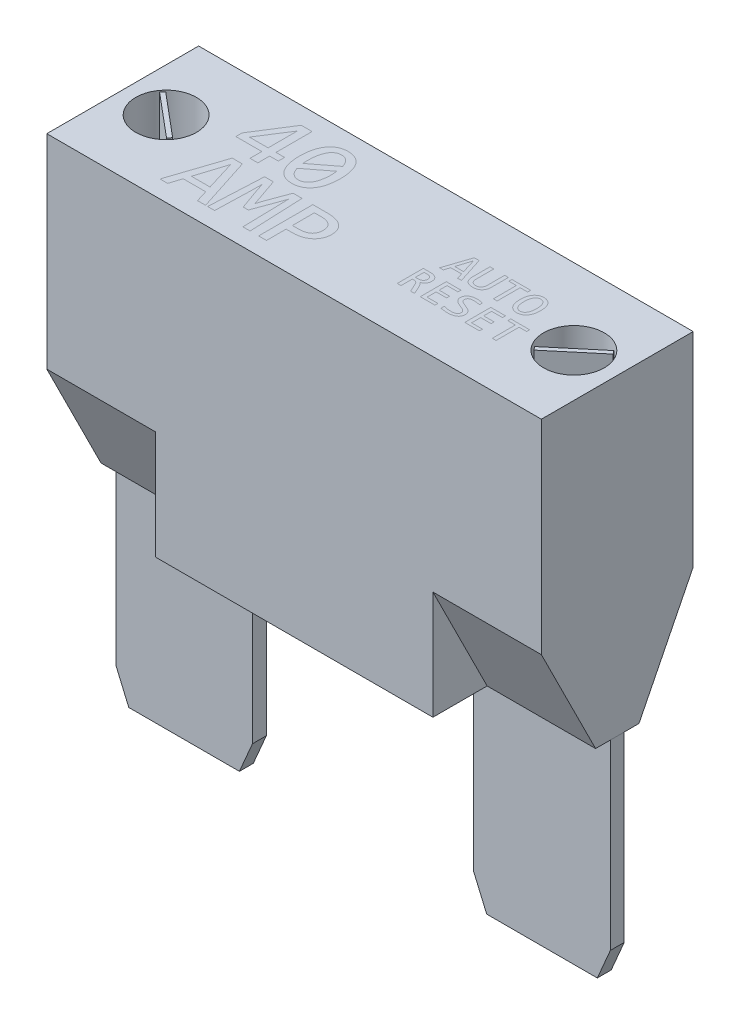
from build123d import *

# Parameters (mm, degrees)
SKETCH1_W              = 8.001
SKETCH1_H              = 0.8128
BOSS_EXTRUDE1_DEPTH    = 12.446
BOSS_EXTRUDE1_2_DEPTH  = 12.446
CUT_EXTRUDE8_DEPTH     = 0.8128
SKETCH7_W              = 28.956
SKETCH7_H              = 8.89
BOSS_EXTRUDE2_DEPTH    = 18.288
CUT_EXTRUDE9_DEPTH     = 6.35
CUT_EXTRUDE10_DEPTH    = 6.35
SKETCH10_R             = 1.778
CUT_EXTRUDE11_DEPTH    = 2.54
BOSS_EXTRUDE3_DEPTH    = 2.54
CUT_EXTRUDE12_DEPTH    = 0.0254
BOSS_EXTRUDE4_DEPTH    = 0.0254
BOSS_EXTRUDE4_2_DEPTH  = 0.0254
BOSS_EXTRUDE4_3_DEPTH  = 0.0254
BOSS_EXTRUDE4_4_DEPTH  = 0.0254
BOSS_EXTRUDE4_5_DEPTH  = 0.0254
BOSS_EXTRUDE4_6_DEPTH  = 0.0254
BOSS_EXTRUDE4_7_DEPTH  = 0.0254
BOSS_EXTRUDE4_8_DEPTH  = 0.0254
BOSS_EXTRUDE4_9_DEPTH  = 0.0254
BOSS_EXTRUDE4_10_DEPTH = 0.0254
BOSS_EXTRUDE4_11_DEPTH = 0.0254
BOSS_EXTRUDE4_12_DEPTH = 0.0254
BOSS_EXTRUDE4_13_DEPTH = 0.0254
BOSS_EXTRUDE4_14_DEPTH = 0.0254


with BuildPart() as part:
    # Sketch1 → Boss-Extrude1 (new body)
    with BuildSketch(Plane(origin=(0, 0, 0), x_dir=(1, 0, 0), z_dir=(0, 1, 0))):
        with Locations((-10.4775, 0)):
            Rectangle(SKETCH1_W, SKETCH1_H)
    extrude(amount=-BOSS_EXTRUDE1_DEPTH)


with BuildPart() as body_2:
    # Sketch1 → Boss-Extrude1 2 (new body)
    with BuildSketch(Plane(origin=(0, 0, 0), x_dir=(1, 0, 0), z_dir=(0, 1, 0))):
        with Locations((10.4775, 0)):
            Rectangle(SKETCH1_W, SKETCH1_H)
    extrude(amount=-BOSS_EXTRUDE1_2_DEPTH)


with BuildPart() as cut_extrude8_tool:
    # Sketch6 → Cut-Extrude8 (new body)
    with BuildSketch(Plane.XY.offset(0.4064)):
        Polygon((-14.478, -10.668), (-13.716, -12.446), (-14.478, -12.446), align=None)
        Polygon((-6.477, -10.668), (-7.239, -12.446), (-6.477, -12.446), align=None)
        Polygon((6.477, -12.446), (6.477, -10.668), (7.239, -12.446), align=None)
        Polygon((14.478, -10.668), (13.716, -12.446), (14.478, -12.446), align=None)
    extrude(amount=-CUT_EXTRUDE8_DEPTH)


with BuildPart() as part_1:
    add(part.part)

    # Cut-Extrude8: cut by cut_extrude8_tool
    add(cut_extrude8_tool.part, mode=Mode.SUBTRACT)


with BuildPart() as body_2_1:
    add(body_2.part)

    # Cut-Extrude8: cut by cut_extrude8_tool
    add(cut_extrude8_tool.part, mode=Mode.SUBTRACT)


with BuildPart() as body_3:
    # Sketch7 → Boss-Extrude2 (new body)
    with BuildSketch(Plane(origin=(0, 0, 0), x_dir=(1, 0, 0), z_dir=(0, 1, 0))):
        Rectangle(SKETCH7_W, SKETCH7_H)
    extrude(amount=BOSS_EXTRUDE2_DEPTH)

    # Sketch8 → Cut-Extrude9 (cut)
    with BuildSketch(Plane(origin=(14.478, 0, 0), x_dir=(0, 0, -1), z_dir=(1, 0, 0))):
        Polygon((-4.445, 6.35), (-1.27, 0), (-4.445, 0), align=None)
        Polygon((4.445, 6.35), (1.27, 0), (4.445, 0), align=None)
    extrude(amount=-CUT_EXTRUDE9_DEPTH, mode=Mode.SUBTRACT)

    # Sketch9 → Cut-Extrude10 (cut)
    with BuildSketch(Plane.ZY.offset(14.478)):
        Polygon((-4.445, 6.35), (-1.27, 0), (-4.445, 0), align=None)
        Polygon((4.445, 6.35), (1.27, 0), (4.445, 0), align=None)
    extrude(amount=-CUT_EXTRUDE10_DEPTH, mode=Mode.SUBTRACT)

    # Sketch10 → Cut-Extrude11 (cut)
    with BuildSketch(Plane(origin=(0, 18.288, 0), x_dir=(1, 0, 0), z_dir=(0, 1, 0))):
        with Locations((-11.938, 0)):
            Circle(SKETCH10_R)
        with Locations((11.938, 0)):
            Circle(SKETCH10_R)
    extrude(amount=-CUT_EXTRUDE11_DEPTH, mode=Mode.SUBTRACT)

    # Sketch11 → Boss-Extrude3 (add)
    with BuildSketch(Plane(origin=(0, 18.288, 0), x_dir=(1, 0, 0), z_dir=(0, 1, 0))):
        Polygon((-13.284373402, 0.963954699), (-10.754894651, -1.158529988), (-10.591626598, -0.963954699), (-13.121105349, 1.158529988), align=None)
        Polygon((13.280626018, 0.960810271), (10.758642035, -1.155385559), (10.595373982, -0.960810271), (13.117357965, 1.155385559), align=None)
    extrude(amount=-BOSS_EXTRUDE3_DEPTH)

    # Sketch12 → Cut-Extrude12 (cut)
    # profile 1 of 14: a face of its own
    with BuildSketch(Plane(origin=(0, 18.288, 0), x_dir=(1, 0, 0), z_dir=(0, 1, 0))):
        Polygon((-6.313188406, 0.944217391), (-6.819347826, 0.944217391), (-6.819347826, 0.254), (-7.279492754, 0.254), (-7.279492754, 0.944217391), (-8.797971014, 0.944217391), (-8.797971014, 1.312333333), (-7.454204031, 3.429), (-6.819347826, 3.429), (-6.819347826, 1.312333333), (-6.313188406, 1.312333333), align=None)
        Polygon((-7.279492754, 3.019183424), (-8.375931839, 1.312333333), (-7.279492754, 1.312333333), align=None, mode=Mode.SUBTRACT)
    # profile 2 of 14: a face of its own
    with BuildSketch(Plane(origin=(0, 18.288, 0), x_dir=(1, 0, 0), z_dir=(0, 1, 0))):
        with BuildLine():
            add(Edge.make_bspline(
                [(-3.598333333, 1.840062047), (-3.59898919, 1.780592632), (-3.600273855, 1.664106242), (-3.615371806, 1.493713616), (-3.637924766, 1.331079099), (-3.67013437, 1.17681535), (-3.711003473, 1.031453394), (-3.763472607, 0.896757786), (-3.823995868, 0.772141749), (-3.894702862, 0.65852318), (-3.97465172, 0.556671662), (-4.063903259, 0.466369001), (-4.162604637, 0.388488142), (-4.270783193, 0.323306291), (-4.388035326, 0.270633189), (-4.515711307, 0.234673729), (-4.652710154, 0.211539332), (-4.747398358, 0.209193333), (-4.796148098, 0.207985507)],
                knots=[0, 0, 0, 0, 1.248871528, 2.446241243, 3.590357027, 4.69618527, 5.754202854, 6.758290001, 7.728669934, 8.660396172, 9.563796911, 10.443071522, 11.321307858, 12.197637495, 13.090115231, 14.012601613, 14.976798049, 16, 16, 16, 16], degree=3))
            add(Edge.make_bspline(
                [(-4.796148098, 0.207985507), (-4.838390061, 0.209013809), (-4.921593023, 0.211039231), (-5.043392045, 0.229308822), (-5.159196553, 0.259800109), (-5.269216829, 0.301082932), (-5.372132575, 0.356275864), (-5.467401795, 0.42431595), (-5.555432932, 0.504872113), (-5.634721494, 0.599358132), (-5.706054435, 0.706813753), (-5.767933911, 0.828412285), (-5.821432509, 0.963027265), (-5.867106133, 1.111214651), (-5.901577811, 1.273702379), (-5.927474321, 1.449917838), (-5.942376805, 1.640408657), (-5.944153144, 1.771972795), (-5.945072464, 1.840062047)],
                knots=[0, 0, 0, 0, 0.897102697, 1.767001224, 2.609309556, 3.43771295, 4.257811968, 5.082953918, 5.919052252, 6.786174452, 7.6970727, 8.653553743, 9.679470751, 10.771494031, 11.944028827, 13.204944144, 14.553456404, 16, 16, 16, 16], degree=3))
            add(Edge.make_bspline(
                [(-5.945072464, 1.840062047), (-5.944000812, 1.899519799), (-5.941897858, 2.016196562), (-5.928524033, 2.187229793), (-5.904692469, 2.350258345), (-5.87197325, 2.504816028), (-5.829775538, 2.650351699), (-5.778230564, 2.785587786), (-5.717763084, 2.910244755), (-5.647839708, 3.024016126), (-5.568246273, 3.12626536), (-5.478749188, 3.2165907), (-5.379981032, 3.294730413), (-5.271145682, 3.35968117), (-5.153399385, 3.412240335), (-5.025768318, 3.448252231), (-4.889500912, 3.471432094), (-4.795528381, 3.473798794), (-4.747257699, 3.475014493)],
                knots=[0, 0, 0, 0, 1.248165713, 2.449334701, 3.598380242, 4.704508407, 5.763215836, 6.776019403, 7.739017366, 8.667464557, 9.574217704, 10.452902578, 11.330549874, 12.210601904, 13.107080692, 14.028948355, 14.987533857, 16, 16, 16, 16], degree=3))
            add(Edge.make_bspline(
                [(-4.747257699, 3.475014493), (-4.705014742, 3.473986192), (-4.621809823, 3.471960773), (-4.500254814, 3.453725639), (-4.38453197, 3.423308058), (-4.274951653, 3.380802853), (-4.171473977, 3.326481204), (-4.076458245, 3.257683209), (-3.988661831, 3.176679138), (-3.909583048, 3.081565159), (-3.837988596, 2.973720252), (-3.775540823, 2.85237969), (-3.722552566, 2.717269334), (-3.677435706, 2.569241237), (-3.641452351, 2.407036254), (-3.616034841, 2.230902708), (-3.600980973, 2.04020162), (-3.599237285, 1.908393285), (-3.598333333, 1.840062047)],
                knots=[0, 0, 0, 0, 0.896490568, 1.765795528, 2.602608418, 3.432274242, 4.256303472, 5.076742829, 5.915718828, 6.786140009, 7.696416714, 8.659101079, 9.677705081, 10.773848187, 11.941709476, 13.20176442, 14.549356535, 16, 16, 16, 16], degree=3))
        make_face()
        with BuildLine():
            add(Edge.make_bspline(
                [(-4.058478261, 1.815616848), (-4.058640803, 1.843190006), (-4.058964753, 1.898143895), (-4.065089075, 1.980034435), (-4.070208324, 2.060864608), (-4.075351537, 2.114242666), (-4.077890625, 2.140594203)],
                knots=[0, 0, 0, 0, 1.015676625, 2.024265076, 3.024624451, 4, 4, 4, 4], degree=3))
            Line((-4.077890625, 2.140594203), (-5.39505548, 1.128275362))
            add(Edge.make_bspline(
                [(-5.39505548, 1.128275362), (-5.38208987, 1.089432515), (-5.356659016, 1.013245833), (-5.307583859, 0.905840321), (-5.247431414, 0.80991215), (-5.175119888, 0.728243214), (-5.091043932, 0.662657611), (-5.012751277, 0.620807866), (-4.944456327, 0.598186543), (-4.889719168, 0.584851137), (-4.831304463, 0.578095003), (-4.791368581, 0.576775149), (-4.770983922, 0.576101449)],
                knots=[0, 0, 0, 0, 1.361870802, 2.671184605, 3.91877896, 5.116024374, 6.280451232, 7.450298556, 8.047911377, 8.670688444, 9.321473259, 10, 10, 10, 10], degree=3))
            add(Edge.make_bspline(
                [(-4.770983922, 0.576101449), (-4.744539765, 0.577014484), (-4.692405529, 0.578814518), (-4.616346344, 0.594737943), (-4.543755473, 0.618831611), (-4.4754957, 0.654166656), (-4.411088169, 0.698504373), (-4.352997498, 0.754325878), (-4.298300045, 0.817890266), (-4.249686818, 0.891854382), (-4.20587018, 0.974991375), (-4.166886439, 1.067515869), (-4.134263765, 1.169635737), (-4.107123731, 1.281174446), (-4.084788676, 1.401614398), (-4.069295353, 1.531525924), (-4.059832168, 1.670480208), (-4.058938956, 1.766231145), (-4.058478261, 1.815616848)],
                knots=[0, 0, 0, 0, 0.796240393, 1.569775284, 2.332781704, 3.095240773, 3.878796528, 4.681173991, 5.516437293, 6.40201063, 7.34239963, 8.345981007, 9.424260963, 10.57011489, 11.804224653, 13.114209461, 14.5115885, 16, 16, 16, 16], degree=3))
        make_face(mode=Mode.SUBTRACT)
        with BuildLine():
            add(Edge.make_bspline(
                [(-5.484927536, 1.845094882), (-5.484957437, 1.819451254), (-5.48501724, 1.768162877), (-5.484571399, 1.691694357), (-5.482034872, 1.616359148), (-5.477712993, 1.566836997), (-5.475580842, 1.542405797)],
                knots=[0, 0, 0, 0, 1.015676347, 2.03139705, 3.028811753, 4, 4, 4, 4], degree=3))
            Line((-5.475580842, 1.542405797), (-4.157697011, 2.554724638))
            add(Edge.make_bspline(
                [(-4.157697011, 2.554724638), (-4.170160985, 2.594159637), (-4.19439935, 2.670847848), (-4.245732491, 2.776869222), (-4.304360922, 2.872552726), (-4.37666754, 2.952914743), (-4.458499438, 3.020126627), (-4.536699913, 3.060885713), (-4.603598649, 3.084911318), (-4.657284566, 3.098105093), (-4.714011021, 3.104887447), (-4.752754583, 3.1062214), (-4.772421875, 3.106898551)],
                knots=[0, 0, 0, 0, 1.387569518, 2.698370158, 3.946895934, 5.144331536, 6.312393877, 7.486406228, 8.084826247, 8.697958228, 9.339048001, 10, 10, 10, 10], degree=3))
            add(Edge.make_bspline(
                [(-4.772421875, 3.106898551), (-4.798856687, 3.105958205), (-4.850972499, 3.104104328), (-4.927020605, 3.08860381), (-4.999283966, 3.063016098), (-5.067823407, 3.02762156), (-5.132347633, 2.982283566), (-5.190590606, 2.925490517), (-5.246101727, 2.860876425), (-5.294337792, 2.784545186), (-5.338236364, 2.69967695), (-5.376522335, 2.60503517), (-5.408910549, 2.501015845), (-5.437364219, 2.387852303), (-5.458347291, 2.265223547), (-5.47419079, 2.13351063), (-5.483547697, 1.992381646), (-5.484458153, 1.895197747), (-5.484927536, 1.845094882)],
                knots=[0, 0, 0, 0, 0.786453526, 1.550480632, 2.299704824, 3.062398082, 3.840423392, 4.637837687, 5.478332318, 6.370910143, 7.318703432, 8.320397478, 9.40580758, 10.560070273, 11.791787257, 13.106920475, 14.508481623, 16, 16, 16, 16], degree=3))
        make_face(mode=Mode.SUBTRACT)
    # profile 3 of 14: a face of its own
    with BuildSketch(Plane(origin=(0, 18.288, 0), x_dir=(1, 0, 0), z_dir=(0, 1, 0))):
        Polygon((-6.198152174, -3.429), (-6.669081748, -3.429), (-6.881898777, -2.738782609), (-8.200501585, -2.738782609), (-8.418351449, -3.429), (-8.866992754, -3.429), (-7.811535326, -0.254), (-7.219817708, -0.254), align=None)
        Polygon((-6.99477808, -2.370666667), (-7.532572464, -0.624272871), (-8.0840274, -2.370666667), align=None, mode=Mode.SUBTRACT)
    # profile 4 of 14: a face of its own
    with BuildSketch(Plane(origin=(0, 18.288, 0), x_dir=(1, 0, 0), z_dir=(0, 1, 0))):
        Polygon((-3.590424592, -3.429), (-4.012463768, -3.429), (-4.06063519, -1.415865942), (-4.081485507, -0.693294611), (-4.231751585, -1.123242527), (-4.706995018, -2.416681159), (-5.006089221, -2.416681159), (-5.45185462, -1.172132926), (-5.599963768, -0.693294611), (-5.610029438, -1.450376812), (-5.668985507, -3.429), (-6.076645154, -3.429), (-5.918470335, -0.254), (-5.405840127, -0.254), (-4.978768116, -1.483449728), (-4.840724638, -1.898299139), (-4.704838089, -1.483449728), (-4.24900702, -0.254), (-3.722716259, -0.254), align=None)
    # profile 5 of 14: a face of its own
    with BuildSketch(Plane(origin=(0, 18.288, 0), x_dir=(1, 0, 0), z_dir=(0, 1, 0))):
        with BuildLine():
            add(Edge.make_bspline(
                [(-1.021521739, -1.220304348), (-1.022298731, -1.252467848), (-1.023859701, -1.317084041), (-1.038270534, -1.413548636), (-1.060585631, -1.509496309), (-1.09123982, -1.604296136), (-1.131441648, -1.696547624), (-1.181678504, -1.784606401), (-1.243089588, -1.866818266), (-1.312558737, -1.944933488), (-1.392881004, -2.016328267), (-1.483672123, -2.080655584), (-1.584674946, -2.137925068), (-1.695586413, -2.188887417), (-1.817860435, -2.228879585), (-1.951157791, -2.258556697), (-2.095952153, -2.27552576), (-2.196284837, -2.277577952), (-2.248095562, -2.278637681)],
                knots=[0, 0, 0, 0, 0.84837333, 1.704374698, 2.568122001, 3.446177459, 4.329841521, 5.219461111, 6.115085959, 7.03322926, 7.973947317, 8.94447037, 9.964314875, 11.034235969, 12.160282575, 13.352588404, 14.632904974, 16, 16, 16, 16], degree=3))
            Line((-2.248095562, -2.278637681), (-2.632028986, -2.278637681))
            Line((-2.632028986, -2.278637681), (-2.632028986, -3.429))
            Line((-2.632028986, -3.429), (-3.092173913, -3.429))
            Line((-3.092173913, -3.429), (-3.092173913, -0.254))
            Line((-3.092173913, -0.254), (-2.204237998, -0.254))
            add(Edge.make_bspline(
                [(-2.204237998, -0.254), (-2.165626663, -0.254408925), (-2.088986734, -0.255220604), (-1.975512299, -0.26608648), (-1.864232405, -0.281393485), (-1.756052971, -0.304276872), (-1.652177514, -0.334298678), (-1.553491615, -0.370943866), (-1.462721068, -0.418740493), (-1.377484905, -0.472299479), (-1.298984873, -0.534126675), (-1.229925478, -0.60587632), (-1.169018323, -0.685806381), (-1.11626744, -0.773728948), (-1.072835349, -0.871133591), (-1.043645676, -0.979056443), (-1.024049923, -1.096408537), (-1.022384226, -1.178037442), (-1.021521739, -1.220304348)],
                knots=[0, 0, 0, 0, 1.071095419, 2.126025337, 3.160633674, 4.187194637, 5.191188192, 6.159546808, 7.102471747, 8.032359578, 8.950543616, 9.867691343, 10.788184798, 11.733733012, 12.707489344, 13.737062018, 14.82826569, 16, 16, 16, 16], degree=3))
        make_face()
        with BuildLine():
            add(Edge.make_bspline(
                [(-1.481666667, -1.244749547), (-1.482125674, -1.220271575), (-1.483020297, -1.172563094), (-1.492637019, -1.103471885), (-1.507780639, -1.038707722), (-1.528408439, -0.978326733), (-1.555149536, -0.92214918), (-1.58858606, -0.870943536), (-1.627658652, -0.823641063), (-1.673029291, -0.781357376), (-1.72380653, -0.744137099), (-1.778466174, -0.710492257), (-1.838770479, -0.683304329), (-1.903889736, -0.661264376), (-1.97346432, -0.642942742), (-2.048168807, -0.63141261), (-2.127109097, -0.622851615), (-2.181444742, -0.622365096), (-2.209270833, -0.622115942)],
                knots=[0, 0, 0, 0, 1.07893025, 2.102875295, 3.069403633, 4.00867391, 4.911619206, 5.805799344, 6.69897942, 7.61127936, 8.532960211, 9.47193309, 10.436783978, 11.442898866, 12.50165651, 13.605056338, 14.773513735, 16, 16, 16, 16], degree=3))
            Line((-2.209270833, -0.622115942), (-2.632028986, -0.622115942))
            Line((-2.632028986, -0.622115942), (-2.632028986, -1.910521739))
            Line((-2.632028986, -1.910521739), (-2.245938632, -1.910521739))
            add(Edge.make_bspline(
                [(-2.245938632, -1.910521739), (-2.216207714, -1.909876883), (-2.158575359, -1.908626852), (-2.074450099, -1.901620842), (-1.995499393, -1.889019303), (-1.922081155, -1.870063342), (-1.853879324, -1.847177149), (-1.790772133, -1.819220937), (-1.733084945, -1.785172632), (-1.680364857, -1.746363626), (-1.632975412, -1.702421705), (-1.592725255, -1.652164934), (-1.557892831, -1.597344829), (-1.529579673, -1.536968414), (-1.508387591, -1.471147789), (-1.492479782, -1.40043915), (-1.483020857, -1.324333351), (-1.482127948, -1.271858405), (-1.481666667, -1.244749547)],
                knots=[0, 0, 0, 0, 1.232805628, 2.389751021, 3.4973379, 4.54330244, 5.530003372, 6.477393866, 7.399377973, 8.301660217, 9.187431021, 10.070466494, 10.963674817, 11.874940633, 12.827061481, 13.825105319, 14.876436953, 16, 16, 16, 16], degree=3))
        make_face(mode=Mode.SUBTRACT)
    # profile 6 of 14: a face of its own
    with BuildSketch(Plane(origin=(0, 18.288, 0), x_dir=(1, 0, 0), z_dir=(0, 1, 0))):
        Polygon((5.102086957, 0.254), (4.876040761, 0.254), (4.773888587, 0.585304348), (4.140959239, 0.585304348), (4.036391304, 0.254), (3.821043478, 0.254), (4.327663043, 1.778), (4.6116875, 1.778), align=None)
        Polygon((4.719706522, 0.762), (4.461565217, 1.600269022), (4.196866848, 0.762), align=None, mode=Mode.SUBTRACT)
    # profile 7 of 14: a face of its own
    with BuildSketch(Plane(origin=(0, 18.288, 0), x_dir=(1, 0, 0), z_dir=(0, 1, 0))):
        with BuildLine():
            add(Edge.make_bspline(
                [(6.327913043, 0.783741848), (6.327401069, 0.763250254), (6.326397465, 0.723081395), (6.319949448, 0.664264032), (6.308504254, 0.608502616), (6.292755679, 0.555855254), (6.272253561, 0.506672934), (6.247900617, 0.460940432), (6.218891823, 0.419076786), (6.185770712, 0.380997676), (6.148254928, 0.347084002), (6.106944972, 0.317209028), (6.061611428, 0.291626846), (6.012634929, 0.269696754), (5.95953003, 0.25304329), (5.902893905, 0.24040343), (5.842299209, 0.233243571), (5.800605311, 0.232364538), (5.779190217, 0.231913043)],
                knots=[0, 0, 0, 0, 1.11533168, 2.186340517, 3.215329593, 4.209637775, 5.172397981, 6.11082755, 7.024364469, 7.938480506, 8.851566745, 9.770835784, 10.707404611, 11.680049096, 12.68592053, 13.731069016, 14.834616795, 16, 16, 16, 16], degree=3))
            add(Edge.make_bspline(
                [(5.779190217, 0.231913043), (5.755820658, 0.232369214), (5.710927959, 0.233245512), (5.646251704, 0.24010471), (5.587095574, 0.251716005), (5.533126551, 0.267822279), (5.484513813, 0.28869025), (5.440631829, 0.313299383), (5.401320044, 0.341615881), (5.366831738, 0.374046025), (5.336978332, 0.410149635), (5.311779684, 0.449813162), (5.290457558, 0.492675381), (5.273696504, 0.539035552), (5.261070329, 0.588432808), (5.252208078, 0.640611444), (5.246491593, 0.695496353), (5.245936099, 0.733111158), (5.245652174, 0.752336957)],
                knots=[0, 0, 0, 0, 1.312563004, 2.521420972, 3.648051293, 4.694693708, 5.678954229, 6.613532698, 7.515738083, 8.393474785, 9.265531829, 10.140290115, 11.027490559, 11.949473662, 12.903968408, 13.887719697, 14.920364614, 16, 16, 16, 16], degree=3))
            Line((5.245652174, 0.752336957), (5.245652174, 1.778))
            Line((5.245652174, 1.778), (5.466521739, 1.778))
            Line((5.466521739, 1.778), (5.466521739, 0.770627717))
            add(Edge.make_bspline(
                [(5.466521739, 0.770627717), (5.46670342, 0.756126893), (5.467054255, 0.728125065), (5.470227321, 0.687452208), (5.475294633, 0.649514473), (5.482475527, 0.614183274), (5.491864444, 0.581383884), (5.504937838, 0.551786476), (5.519581068, 0.524333416), (5.537771574, 0.500087101), (5.55847948, 0.478573133), (5.582103088, 0.459978564), (5.608420908, 0.44413211), (5.637661524, 0.430851085), (5.670172184, 0.420941159), (5.705778576, 0.413857137), (5.744787603, 0.409201013), (5.771928474, 0.408811809), (5.786092391, 0.408608696)],
                knots=[0, 0, 0, 0, 1.246642402, 2.407329763, 3.505429403, 4.535490685, 5.505633834, 6.431662104, 7.312644057, 8.175164385, 9.028562083, 9.873549447, 10.752251869, 11.664173984, 12.627739815, 13.667491001, 14.782741197, 16, 16, 16, 16], degree=3))
            add(Edge.make_bspline(
                [(5.786092391, 0.408608696), (5.799333284, 0.408839078), (5.825091294, 0.409287251), (5.862325546, 0.413728741), (5.896826916, 0.421444065), (5.928772294, 0.431594289), (5.95791951, 0.445167486), (5.984498271, 0.46154225), (6.008515059, 0.480811368), (6.02927842, 0.50366193), (6.047593145, 0.528947382), (6.063516006, 0.55672893), (6.076981548, 0.586919199), (6.088012, 0.619510496), (6.096569544, 0.654502746), (6.102838726, 0.691863883), (6.106108259, 0.731687386), (6.106725989, 0.759003866), (6.107043478, 0.773043478)],
                knots=[0, 0, 0, 0, 1.143906156, 2.225283924, 3.233450169, 4.19541835, 5.116075032, 6.004390991, 6.887798474, 7.767169552, 8.663955608, 9.581332573, 10.529122189, 11.516238804, 12.550580461, 13.639017649, 14.7865465, 16, 16, 16, 16], degree=3))
            Line((6.107043478, 0.773043478), (6.107043478, 1.778))
            Line((6.107043478, 1.778), (6.327913043, 1.778))
            Line((6.327913043, 1.778), (6.327913043, 0.783741848))
        make_face()
    # profile 8 of 14: a face of its own
    with BuildSketch(Plane(origin=(0, 18.288, 0), x_dir=(1, 0, 0), z_dir=(0, 1, 0))):
        Polygon((7.631043478, 1.601304348), (7.189304348, 1.601304348), (7.189304348, 0.254), (6.968434783, 0.254), (6.968434783, 1.601304348), (6.526695652, 1.601304348), (6.526695652, 1.778), (7.631043478, 1.778), align=None)
    # profile 9 of 14: a face of its own
    with BuildSketch(Plane(origin=(0, 18.288, 0), x_dir=(1, 0, 0), z_dir=(0, 1, 0))):
        with BuildLine():
            add(Edge.make_bspline(
                [(8.95626087, 1.026008152), (8.955688105, 0.992855042), (8.95458209, 0.928835921), (8.945471689, 0.836337791), (8.931024972, 0.750717983), (8.909947212, 0.672110817), (8.883489397, 0.600532269), (8.853629875, 0.535039986), (8.819084665, 0.476155817), (8.780388022, 0.42366151), (8.737624449, 0.378010856), (8.691917721, 0.337880804), (8.64175406, 0.30527639), (8.588940125, 0.278161225), (8.533485512, 0.257569734), (8.476402899, 0.242592643), (8.417699885, 0.233857188), (8.378116798, 0.232564092), (8.3581875, 0.231913043)],
                knots=[0, 0, 0, 0, 1.423082774, 2.747992794, 3.986236128, 5.147128242, 6.236197569, 7.259302453, 8.233395673, 9.161912359, 10.053001658, 10.914402565, 11.766421957, 12.614596425, 13.458547256, 14.300675266, 15.144423756, 16, 16, 16, 16], degree=3))
            add(Edge.make_bspline(
                [(8.3581875, 0.231913043), (8.334681505, 0.232554654), (8.289055688, 0.233800038), (8.222961837, 0.244031896), (8.1615016, 0.260417884), (8.104617944, 0.283673164), (8.052755613, 0.31358751), (8.005145993, 0.349059811), (7.962545544, 0.39089019), (7.924449598, 0.438394931), (7.891155563, 0.491750331), (7.862676637, 0.550621749), (7.838465188, 0.614848977), (7.818962569, 0.68439114), (7.803898414, 0.758926094), (7.793461742, 0.838147427), (7.786662588, 0.921781294), (7.785994493, 0.979059437), (7.785652174, 1.008407609)],
                knots=[0, 0, 0, 0, 1.030115455, 1.999483942, 2.924432069, 3.813267415, 4.685316872, 5.542716903, 6.40939724, 7.295524004, 8.206506083, 9.160640047, 10.158252241, 11.211975818, 12.323750963, 13.4892538, 14.713543989, 16, 16, 16, 16], degree=3))
            add(Edge.make_bspline(
                [(7.785652174, 1.008407609), (7.786271525, 1.041211293), (7.787469032, 1.104636816), (7.79598738, 1.196492929), (7.810640069, 1.281583367), (7.831349011, 1.359957656), (7.857288799, 1.43155702), (7.887361306, 1.496827028), (7.921273561, 1.555916559), (7.960288603, 1.608002459), (8.002992764, 1.653789899), (8.048747953, 1.693805454), (8.098462595, 1.726826319), (8.150990446, 1.753903957), (8.206261062, 1.774358029), (8.263195395, 1.789459876), (8.321799783, 1.798133611), (8.361381283, 1.799432827), (8.381309783, 1.800086957)],
                knots=[0, 0, 0, 0, 1.41309666, 2.732205102, 3.969807196, 5.128608405, 6.219709524, 7.24631839, 8.221244419, 9.148965463, 10.043106611, 10.914447659, 11.761129373, 12.607796584, 13.454637821, 14.294855332, 15.141493535, 16, 16, 16, 16], degree=3))
            add(Edge.make_bspline(
                [(8.381309783, 1.800086957), (8.404811844, 1.799425608), (8.450543784, 1.798138712), (8.516723067, 1.78815197), (8.578122186, 1.771164654), (8.634798751, 1.747579849), (8.686920142, 1.717693097), (8.734428806, 1.68196955), (8.77744088, 1.640449331), (8.815269399, 1.592861896), (8.848972221, 1.539861048), (8.878365131, 1.481570478), (8.902284, 1.417420899), (8.922318507, 1.348334582), (8.937603565, 1.274226663), (8.94858579, 1.195498081), (8.955216764, 1.112285307), (8.955907115, 1.055239806), (8.95626087, 1.026008152)],
                knots=[0, 0, 0, 0, 1.031800753, 2.007749398, 2.930678117, 3.822900438, 4.696376593, 5.562252438, 6.426830471, 7.314406963, 8.225311853, 9.18096675, 10.175487812, 11.227471919, 12.337140194, 13.495232744, 14.716489688, 16, 16, 16, 16], degree=3))
        make_face()
        with BuildLine():
            add(Edge.make_bspline(
                [(8.735391304, 1.011168478), (8.735057281, 1.033257307), (8.73440275, 1.076541237), (8.731309601, 1.140040478), (8.724395366, 1.200544671), (8.716110963, 1.25809323), (8.704899918, 1.312358443), (8.690308083, 1.362821999), (8.673353972, 1.409692114), (8.652552754, 1.452324038), (8.628741344, 1.490716487), (8.602109556, 1.525200378), (8.571587536, 1.554466298), (8.538101815, 1.579430842), (8.501223296, 1.599329366), (8.460632184, 1.613606433), (8.416389016, 1.621905496), (8.38571685, 1.622886238), (8.369921196, 1.623391304)],
                knots=[0, 0, 0, 0, 1.323673599, 2.593790554, 3.807090586, 4.970987518, 6.076778004, 7.123914636, 8.116191169, 9.059475772, 9.960330598, 10.819370074, 11.662669578, 12.485668992, 13.315223066, 14.163241623, 15.054100047, 16, 16, 16, 16], degree=3))
            add(Edge.make_bspline(
                [(8.369921196, 1.623391304), (8.354586628, 1.62275306), (8.324700774, 1.621509172), (8.281340307, 1.613027338), (8.241636716, 1.597536072), (8.205341079, 1.576534355), (8.172413237, 1.550514151), (8.143038704, 1.519552271), (8.115917121, 1.485141614), (8.092412311, 1.446085388), (8.072471255, 1.403155934), (8.054052248, 1.357017512), (8.03976136, 1.306940357), (8.027116395, 1.253921275), (8.018065854, 1.198182538), (8.011648709, 1.140583686), (8.007254567, 1.081292756), (8.006768629, 1.041200976), (8.006521739, 1.020831522)],
                knots=[0, 0, 0, 0, 0.938104053, 1.828290259, 2.688226573, 3.533173995, 4.38495139, 5.245952462, 6.138444459, 7.060521377, 8.026891732, 9.031849607, 10.096184638, 11.209149641, 12.36492099, 13.547735175, 14.754076334, 16, 16, 16, 16], degree=3))
            add(Edge.make_bspline(
                [(8.006521739, 1.020831522), (8.006793101, 0.998508291), (8.007322241, 0.954979217), (8.011266173, 0.891086384), (8.01722294, 0.830243516), (8.026182821, 0.772514752), (8.037731515, 0.718409205), (8.052239144, 0.668115317), (8.069410902, 0.621627024), (8.089585621, 0.579051497), (8.113269354, 0.540816549), (8.139666975, 0.506535397), (8.170205729, 0.477604999), (8.202883617, 0.452116486), (8.239851322, 0.432689424), (8.280023059, 0.41847925), (8.323904882, 0.410058096), (8.354238933, 0.409102648), (8.369921196, 0.408608696)],
                knots=[0, 0, 0, 0, 1.340540585, 2.613980496, 3.843097936, 5.010722051, 6.120504555, 7.163418743, 8.151508278, 9.093960035, 9.987380757, 10.848401497, 11.683877306, 12.507385072, 13.329500698, 14.179475102, 15.05881515, 16, 16, 16, 16], degree=3))
            add(Edge.make_bspline(
                [(8.369921196, 0.408608696), (8.385269413, 0.409187149), (8.415092395, 0.410311137), (8.458137581, 0.419572937), (8.498013664, 0.434422644), (8.534485157, 0.455483541), (8.567747792, 0.481480954), (8.59750753, 0.512328827), (8.624599913, 0.5469495), (8.648384469, 0.585982024), (8.66928575, 0.628653828), (8.687265448, 0.674983585), (8.70242504, 0.724575945), (8.714217353, 0.777601007), (8.724009742, 0.8330763), (8.730237802, 0.890848529), (8.734667343, 0.950360515), (8.735147415, 0.990683357), (8.735391304, 1.011168478)],
                knots=[0, 0, 0, 0, 0.936906737, 1.820494917, 2.676828052, 3.526792157, 4.383009914, 5.247809723, 6.13916262, 7.06372975, 8.034989121, 9.038664354, 10.096936984, 11.200050273, 12.355522744, 13.536827286, 14.74863997, 16, 16, 16, 16], degree=3))
        make_face(mode=Mode.SUBTRACT)
    # profile 10 of 14: a face of its own
    with BuildSketch(Plane(origin=(0, 18.288, 0), x_dir=(1, 0, 0), z_dir=(0, 1, 0))):
        with BuildLine():
            Line((4.389782609, -1.778), (4.155798913, -1.778))
            Line((4.155798913, -1.778), (3.936654891, -1.302095109))
            add(Edge.make_bspline(
                [(3.936654891, -1.302095109), (3.928736297, -1.285222536), (3.914046323, -1.25392182), (3.888181481, -1.212821335), (3.861392689, -1.179706821), (3.832374344, -1.154248673), (3.800716262, -1.135675788), (3.766217881, -1.123659458), (3.728378743, -1.116674397), (3.702012853, -1.115832902), (3.68817663, -1.115391304)],
                knots=[0, 0, 0, 0, 1.339134837, 2.484261414, 3.482991323, 4.391871607, 5.244507385, 6.105289549, 7.005698766, 8, 8, 8, 8], degree=3))
            Line((3.68817663, -1.115391304), (3.594652174, -1.115391304))
            Line((3.594652174, -1.115391304), (3.594652174, -1.778))
            Line((3.594652174, -1.778), (3.373782609, -1.778))
            Line((3.373782609, -1.778), (3.373782609, -0.254))
            Line((3.373782609, -0.254), (3.778940217, -0.254))
            add(Edge.make_bspline(
                [(3.778940217, -0.254), (3.800235439, -0.254275905), (3.841293111, -0.254807855), (3.900576478, -0.260415529), (3.955224136, -0.269461844), (4.005151829, -0.282696793), (4.050697908, -0.298868926), (4.092018456, -0.318194947), (4.129119113, -0.340562847), (4.16185814, -0.366084809), (4.19080053, -0.393936941), (4.215088735, -0.425134759), (4.235684741, -0.458737948), (4.25184858, -0.49525887), (4.26410452, -0.533976433), (4.273252892, -0.574707095), (4.278360358, -0.617497909), (4.279015067, -0.646720751), (4.279347826, -0.66157337)],
                knots=[0, 0, 0, 0, 1.390037284, 2.680023546, 3.883960013, 5.002565466, 6.047913656, 7.03574216, 7.976084698, 8.870016629, 9.741095147, 10.591561451, 11.444313202, 12.308368875, 13.191986167, 14.092206828, 15.030357037, 16, 16, 16, 16], degree=3))
            add(Edge.make_bspline(
                [(4.279347826, -0.66157337), (4.279072029, -0.673548419), (4.278529639, -0.697098832), (4.274543007, -0.731919105), (4.26850657, -0.765782305), (4.259461708, -0.798531605), (4.24805571, -0.830039346), (4.234280587, -0.860280588), (4.21756422, -0.888921435), (4.198642103, -0.916260229), (4.177112075, -0.941855465), (4.15333414, -0.965793391), (4.126739674, -0.987511961), (4.098355845, -1.007918472), (4.067406312, -1.025974123), (4.034203836, -1.041401607), (3.998917378, -1.054672984), (3.974334458, -1.061296157), (3.961847826, -1.064660326)],
                knots=[0, 0, 0, 0, 1.032708305, 2.030948508, 3.019625047, 3.996933367, 4.957424013, 5.907556856, 6.85893238, 7.814077788, 8.77200233, 9.740252168, 10.719774328, 11.730219428, 12.753012585, 13.805036997, 14.885091985, 16, 16, 16, 16], degree=3))
            add(Edge.make_bspline(
                [(3.961847826, -1.064660326), (3.971996877, -1.068382774), (3.992133273, -1.075768358), (4.019819258, -1.092215248), (4.04585896, -1.111332405), (4.068631272, -1.135764069), (4.090896539, -1.163282616), (4.112966857, -1.194991265), (4.135378929, -1.230774194), (4.149492381, -1.256577202), (4.156834239, -1.27)],
                knots=[0, 0, 0, 0, 0.890820497, 1.767447404, 2.649001527, 3.549193506, 4.515009134, 5.571837998, 6.736863216, 8, 8, 8, 8], degree=3))
            Line((4.156834239, -1.27), (4.389782609, -1.778))
        make_face()
        with BuildLine():
            add(Edge.make_bspline(
                [(4.058478261, -0.676413043), (4.058316681, -0.666394935), (4.058003611, -0.646984392), (4.054538447, -0.618886989), (4.048608965, -0.59279996), (4.040710361, -0.568626556), (4.030841894, -0.546139025), (4.017753957, -0.526112407), (4.002981282, -0.507686543), (3.985917462, -0.491343906), (3.966700201, -0.477127034), (3.945585623, -0.464770762), (3.922769479, -0.453998738), (3.898028487, -0.445305307), (3.871394546, -0.438949653), (3.842941902, -0.433994418), (3.812580283, -0.431359981), (3.791713655, -0.430920875), (3.78101087, -0.430695652)],
                knots=[0, 0, 0, 0, 1.136086502, 2.201219443, 3.204852043, 4.166451082, 5.083443327, 5.98129036, 6.87199526, 7.758098985, 8.653381414, 9.577773354, 10.529401831, 11.511765708, 12.546811162, 13.632454437, 14.78565276, 16, 16, 16, 16], degree=3))
            Line((3.78101087, -0.430695652), (3.594652174, -0.430695652))
            Line((3.594652174, -0.430695652), (3.594652174, -0.938695652))
            Line((3.594652174, -0.938695652), (3.7544375, -0.938695652))
            add(Edge.make_bspline(
                [(3.7544375, -0.938695652), (3.765830799, -0.93849203), (3.788086462, -0.938094273), (3.820551938, -0.935144253), (3.851137257, -0.929324291), (3.880145888, -0.922441672), (3.90715579, -0.912680302), (3.932028731, -0.900870805), (3.955183278, -0.887499985), (3.975789442, -0.871446039), (3.994682371, -0.853792867), (4.011217664, -0.834084979), (4.025602049, -0.812500063), (4.037215468, -0.788743702), (4.047132941, -0.763347381), (4.053374742, -0.735771215), (4.057773402, -0.706693776), (4.058239523, -0.686669212), (4.058478261, -0.676413043)],
                knots=[0, 0, 0, 0, 1.202615583, 2.349188572, 3.435207305, 4.486530095, 5.492783739, 6.45958443, 7.390413995, 8.308405015, 9.210274755, 10.115082188, 11.017605575, 11.940721498, 12.901403136, 13.887978084, 14.918265918, 16, 16, 16, 16], degree=3))
        make_face(mode=Mode.SUBTRACT)
    # profile 11 of 14: a face of its own
    with BuildSketch(Plane(origin=(0, 18.288, 0), x_dir=(1, 0, 0), z_dir=(0, 1, 0))):
        Polygon((5.582478261, -1.778), (4.721086957, -1.778), (4.721086957, -0.254), (5.582478261, -0.254), (5.582478261, -0.430695652), (4.941956522, -0.430695652), (4.941956522, -0.894521739), (5.556940217, -0.894521739), (5.556940217, -1.071217391), (4.941956522, -1.071217391), (4.941956522, -1.601304348), (5.582478261, -1.601304348), align=None)
    # profile 12 of 14: a face of its own
    with BuildSketch(Plane(origin=(0, 18.288, 0), x_dir=(1, 0, 0), z_dir=(0, 1, 0))):
        with BuildLine():
            add(Edge.make_bspline(
                [(6.951869565, -1.365595109), (6.951373598, -1.383229331), (6.950411429, -1.417439425), (6.941946017, -1.467219066), (6.927828382, -1.513456808), (6.908428501, -1.556469156), (6.883471928, -1.595474941), (6.854965873, -1.631881666), (6.820927257, -1.663905177), (6.783218159, -1.693064079), (6.741249584, -1.718725936), (6.69491414, -1.740322734), (6.644847027, -1.758980417), (6.590909142, -1.774024155), (6.533582771, -1.785718627), (6.473150876, -1.793752345), (6.40991708, -1.799174545), (6.366807067, -1.799778813), (6.34482337, -1.800086957)],
                knots=[0, 0, 0, 0, 1.005643061, 1.95093061, 2.870738502, 3.757832008, 4.633806625, 5.507195241, 6.389247641, 7.292512577, 8.223494331, 9.189475669, 10.205094408, 11.269007441, 12.381228937, 13.540657028, 14.745872513, 16, 16, 16, 16], degree=3))
            add(Edge.make_bspline(
                [(6.34482337, -1.800086957), (6.324574234, -1.799860075), (6.284172916, -1.799407399), (6.224092844, -1.796632294), (6.165315158, -1.792047919), (6.108718175, -1.786535239), (6.054730826, -1.780407178), (6.004068329, -1.77331994), (5.957369728, -1.765079149), (5.927802559, -1.758861353), (5.913782609, -1.755913043)],
                knots=[0, 0, 0, 0, 1.119729043, 2.234096861, 3.324996266, 4.379512959, 5.378439906, 6.329323539, 7.207810484, 8, 8, 8, 8], degree=3))
            Line((5.913782609, -1.755913043), (5.913782609, -1.557130435))
            add(Edge.make_bspline(
                [(5.913782609, -1.557130435), (5.928792758, -1.562273368), (5.959462275, -1.572781676), (6.007570269, -1.585106967), (6.058033979, -1.596682321), (6.111332927, -1.606352809), (6.167986376, -1.613963956), (6.228210476, -1.619316783), (6.292207538, -1.622941674), (6.336075285, -1.623238636), (6.358627717, -1.623391304)],
                knots=[0, 0, 0, 0, 0.842364813, 1.72116351, 2.635659137, 3.591954833, 4.596841017, 5.670471508, 6.802388115, 8, 8, 8, 8], degree=3))
            add(Edge.make_bspline(
                [(6.358627717, -1.623391304), (6.374740345, -1.62322544), (6.405732281, -1.622906407), (6.450390083, -1.619570989), (6.491398451, -1.615222449), (6.528669045, -1.607669396), (6.562575919, -1.598975769), (6.59322346, -1.587912827), (6.620563316, -1.574747283), (6.645072425, -1.559988115), (6.666077266, -1.54293522), (6.684492958, -1.524557327), (6.699271608, -1.504055901), (6.711276417, -1.481917476), (6.720150938, -1.458067184), (6.726313737, -1.432568002), (6.730190524, -1.40551557), (6.730725411, -1.386890259), (6.731, -1.377328804)],
                knots=[0, 0, 0, 0, 1.523194236, 2.929797672, 4.233142745, 5.41923506, 6.522104548, 7.540643951, 8.494207191, 9.387815665, 10.238903194, 11.04655015, 11.840679357, 12.619387111, 13.4214478, 14.239285369, 15.096122854, 16, 16, 16, 16], degree=3))
            add(Edge.make_bspline(
                [(6.731, -1.377328804), (6.73065732, -1.367393958), (6.729987794, -1.347983356), (6.723149049, -1.320135941), (6.712456718, -1.294311856), (6.696781219, -1.271280631), (6.678359794, -1.249640838), (6.656718817, -1.229811906), (6.632830209, -1.210637743), (6.596582967, -1.18652538), (6.54586302, -1.158192389), (6.478298309, -1.129858952), (6.40665007, -1.101410467), (6.333119722, -1.071738556), (6.259608121, -1.040241704), (6.187490345, -1.006874154), (6.119852121, -0.968594648), (6.068919335, -0.930611118), (6.033334015, -0.896408183), (6.009124815, -0.869022187), (5.988352281, -0.839116908), (5.969163122, -0.807750005), (5.95415029, -0.773086178), (5.943734355, -0.73545116), (5.936821975, -0.694840233), (5.936194415, -0.666780341), (5.935869565, -0.652255435)],
                knots=[0, 0, 0, 0, 0.619815692, 1.2109895, 1.781199776, 2.357496674, 2.943929778, 3.554333405, 4.188738872, 4.856760597, 6.272963823, 7.811824644, 9.431291666, 11.092170587, 12.76691914, 14.429617761, 16.056218893, 17.616396577, 18.384212937, 19.138341755, 19.896401647, 20.65718422, 21.4332038, 22.247956952, 23.09307348, 24, 24, 24, 24], degree=3))
            add(Edge.make_bspline(
                [(5.935869565, -0.652255435), (5.936265521, -0.639231302), (5.937058406, -0.613151035), (5.94360813, -0.574180958), (5.95390918, -0.535551385), (5.968411369, -0.497402818), (5.987407401, -0.460618165), (6.010526068, -0.425352929), (6.038922795, -0.39288386), (6.071484486, -0.362268143), (6.109155566, -0.334256881), (6.151465206, -0.308704291), (6.199101733, -0.286775294), (6.251153263, -0.266875298), (6.308669151, -0.251078846), (6.371364231, -0.239761886), (6.439250772, -0.233374672), (6.486189551, -0.232411425), (6.510475543, -0.231913043)],
                knots=[0, 0, 0, 0, 0.784067079, 1.570060577, 2.373452904, 3.189297991, 4.022898002, 4.862695015, 5.722463422, 6.614650011, 7.550049647, 8.544652583, 9.586108202, 10.704431291, 11.897970904, 13.172772987, 14.537200697, 16, 16, 16, 16], degree=3))
            add(Edge.make_bspline(
                [(6.510475543, -0.231913043), (6.524054952, -0.232001024), (6.552276352, -0.232183868), (6.595760594, -0.235309847), (6.641115239, -0.239252302), (6.687233747, -0.244899903), (6.733275211, -0.251347333), (6.778476099, -0.258948782), (6.821867004, -0.267061827), (6.849960206, -0.273148645), (6.863521739, -0.276086957)],
                knots=[0, 0, 0, 0, 0.91416123, 1.89985515, 2.934260182, 3.979599391, 5.027947684, 6.064525625, 7.065681407, 8, 8, 8, 8], degree=3))
            Line((6.863521739, -0.276086957), (6.863521739, -0.452782609))
            add(Edge.make_bspline(
                [(6.863521739, -0.452782609), (6.833336133, -0.446087641), (6.773264316, -0.43276411), (6.68285616, -0.419473236), (6.594070153, -0.410165383), (6.535461324, -0.409121387), (6.506679348, -0.408608696)],
                knots=[0, 0, 0, 0, 1.029411825, 2.048613503, 3.041701399, 4, 4, 4, 4], degree=3))
            add(Edge.make_bspline(
                [(6.506679348, -0.408608696), (6.49218117, -0.408830304), (6.464078022, -0.409259869), (6.423392386, -0.411900968), (6.385720569, -0.416737313), (6.351024295, -0.423278452), (6.319207681, -0.43137321), (6.290368644, -0.441657246), (6.264666066, -0.454210268), (6.241667493, -0.468314382), (6.221710586, -0.484280974), (6.204166824, -0.501231574), (6.189519692, -0.519663506), (6.177696348, -0.539573484), (6.168443639, -0.560696794), (6.161257774, -0.582945105), (6.157610674, -0.606696081), (6.157034044, -0.622910857), (6.15673913, -0.631203804)],
                knots=[0, 0, 0, 0, 1.491437277, 2.890989782, 4.191431573, 5.395946596, 6.521058188, 7.565423013, 8.539223212, 9.458660202, 10.334655275, 11.163081303, 11.963306063, 12.748694206, 13.538083787, 14.331542868, 15.146677777, 16, 16, 16, 16], degree=3))
            add(Edge.make_bspline(
                [(6.15673913, -0.631203804), (6.157081426, -0.64113768), (6.157750198, -0.660546384), (6.164619781, -0.688510984), (6.175369277, -0.714407684), (6.190398527, -0.738157778), (6.20954362, -0.759325147), (6.230615402, -0.779915346), (6.254588606, -0.799232014), (6.290764803, -0.823964764), (6.341932251, -0.852150143), (6.409165797, -0.88172183), (6.481211371, -0.909359644), (6.554568123, -0.93932254), (6.62834366, -0.970491724), (6.688470774, -0.999487968), (6.73513549, -1.024378878), (6.767837644, -1.045244997), (6.798888444, -1.06725196), (6.827439686, -1.091564899), (6.854233082, -1.117279653), (6.878184226, -1.145544885), (6.899549573, -1.175745075), (6.917971936, -1.208184032), (6.933729182, -1.242927672), (6.944004568, -1.281152219), (6.950919888, -1.322320239), (6.951545744, -1.350839251), (6.951869565, -1.365595109)],
                knots=[0, 0, 0, 0, 0.667485538, 1.304126353, 1.925325377, 2.548259058, 3.18485279, 3.841928735, 4.529978862, 5.253739616, 6.789399884, 8.452896455, 10.194043647, 11.982660287, 13.786213269, 15.583473082, 16.473910229, 17.343881083, 18.192645259, 19.033319022, 19.865571682, 20.689426309, 21.522902605, 22.351690537, 23.197589349, 24.082454772, 25.007853999, 26, 26, 26, 26], degree=3))
        make_face()
    # profile 13 of 14: a face of its own
    with BuildSketch(Plane(origin=(0, 18.288, 0), x_dir=(1, 0, 0), z_dir=(0, 1, 0))):
        Polygon((8.18873913, -1.778), (7.327347826, -1.778), (7.327347826, -0.254), (8.18873913, -0.254), (8.18873913, -0.430695652), (7.548217391, -0.430695652), (7.548217391, -0.894521739), (8.163201087, -0.894521739), (8.163201087, -1.071217391), (7.548217391, -1.071217391), (7.548217391, -1.601304348), (8.18873913, -1.601304348), align=None)
    # profile 14 of 14: a face of its own
    with BuildSketch(Plane(origin=(0, 18.288, 0), x_dir=(1, 0, 0), z_dir=(0, 1, 0))):
        Polygon((9.602304348, -0.430695652), (9.160565217, -0.430695652), (9.160565217, -1.778), (8.939695652, -1.778), (8.939695652, -0.430695652), (8.497956522, -0.430695652), (8.497956522, -0.254), (9.602304348, -0.254), align=None)
    extrude(amount=-CUT_EXTRUDE12_DEPTH, mode=Mode.SUBTRACT)


with BuildPart() as body_4:
    # Sketch13 → Boss-Extrude4 (new body)
    with BuildSketch(Plane(origin=(0, 18.288, 0), x_dir=(1, 0, 0), z_dir=(0, 1, 0))):
        Polygon((-6.313188406, 0.944217391), (-6.819347826, 0.944217391), (-6.819347826, 0.254), (-7.279492754, 0.254), (-7.279492754, 0.944217391), (-8.797971014, 0.944217391), (-8.797971014, 1.312333333), (-7.454204031, 3.429), (-6.819347826, 3.429), (-6.819347826, 1.312333333), (-6.313188406, 1.312333333), align=None)
        Polygon((-7.279492754, 3.019183424), (-8.375931839, 1.312333333), (-7.279492754, 1.312333333), align=None, mode=Mode.SUBTRACT)
    extrude(amount=-BOSS_EXTRUDE4_DEPTH)


with BuildPart() as body_5:
    # Sketch13 → Boss-Extrude4 2 (new body)
    with BuildSketch(Plane(origin=(0, 18.288, 0), x_dir=(1, 0, 0), z_dir=(0, 1, 0))):
        with BuildLine():
            add(Edge.make_bspline(
                [(-3.598333333, 1.840062047), (-3.59898919, 1.780592632), (-3.600273855, 1.664106242), (-3.615371806, 1.493713616), (-3.637924766, 1.331079099), (-3.67013437, 1.17681535), (-3.711003473, 1.031453394), (-3.763472607, 0.896757786), (-3.823995868, 0.772141749), (-3.894702862, 0.65852318), (-3.97465172, 0.556671662), (-4.063903259, 0.466369001), (-4.162604637, 0.388488142), (-4.270783193, 0.323306291), (-4.388035326, 0.270633189), (-4.515711307, 0.234673729), (-4.652710154, 0.211539332), (-4.747398358, 0.209193333), (-4.796148098, 0.207985507)],
                knots=[0, 0, 0, 0, 1.248871528, 2.446241243, 3.590357027, 4.69618527, 5.754202854, 6.758290001, 7.728669934, 8.660396172, 9.563796911, 10.443071522, 11.321307858, 12.197637495, 13.090115231, 14.012601613, 14.976798049, 16, 16, 16, 16], degree=3))
            add(Edge.make_bspline(
                [(-4.796148098, 0.207985507), (-4.838390061, 0.209013809), (-4.921593023, 0.211039231), (-5.043392045, 0.229308822), (-5.159196553, 0.259800109), (-5.269216829, 0.301082932), (-5.372132575, 0.356275864), (-5.467401795, 0.42431595), (-5.555432932, 0.504872113), (-5.634721494, 0.599358132), (-5.706054435, 0.706813753), (-5.767933911, 0.828412285), (-5.821432509, 0.963027265), (-5.867106133, 1.111214651), (-5.901577811, 1.273702379), (-5.927474321, 1.449917838), (-5.942376805, 1.640408657), (-5.944153144, 1.771972795), (-5.945072464, 1.840062047)],
                knots=[0, 0, 0, 0, 0.897102697, 1.767001224, 2.609309556, 3.43771295, 4.257811968, 5.082953918, 5.919052252, 6.786174452, 7.6970727, 8.653553743, 9.679470751, 10.771494031, 11.944028827, 13.204944144, 14.553456404, 16, 16, 16, 16], degree=3))
            add(Edge.make_bspline(
                [(-5.945072464, 1.840062047), (-5.944000812, 1.899519799), (-5.941897858, 2.016196562), (-5.928524033, 2.187229793), (-5.904692469, 2.350258345), (-5.87197325, 2.504816028), (-5.829775538, 2.650351699), (-5.778230564, 2.785587786), (-5.717763084, 2.910244755), (-5.647839708, 3.024016126), (-5.568246273, 3.12626536), (-5.478749188, 3.2165907), (-5.379981032, 3.294730413), (-5.271145682, 3.35968117), (-5.153399385, 3.412240335), (-5.025768318, 3.448252231), (-4.889500912, 3.471432094), (-4.795528381, 3.473798794), (-4.747257699, 3.475014493)],
                knots=[0, 0, 0, 0, 1.248165713, 2.449334701, 3.598380242, 4.704508407, 5.763215836, 6.776019403, 7.739017366, 8.667464557, 9.574217704, 10.452902578, 11.330549874, 12.210601904, 13.107080692, 14.028948355, 14.987533857, 16, 16, 16, 16], degree=3))
            add(Edge.make_bspline(
                [(-4.747257699, 3.475014493), (-4.705014742, 3.473986192), (-4.621809823, 3.471960773), (-4.500254814, 3.453725639), (-4.38453197, 3.423308058), (-4.274951653, 3.380802853), (-4.171473977, 3.326481204), (-4.076458245, 3.257683209), (-3.988661831, 3.176679138), (-3.909583048, 3.081565159), (-3.837988596, 2.973720252), (-3.775540823, 2.85237969), (-3.722552566, 2.717269334), (-3.677435706, 2.569241237), (-3.641452351, 2.407036254), (-3.616034841, 2.230902708), (-3.600980973, 2.04020162), (-3.599237285, 1.908393285), (-3.598333333, 1.840062047)],
                knots=[0, 0, 0, 0, 0.896490568, 1.765795528, 2.602608418, 3.432274242, 4.256303472, 5.076742829, 5.915718828, 6.786140009, 7.696416714, 8.659101079, 9.677705081, 10.773848187, 11.941709476, 13.20176442, 14.549356535, 16, 16, 16, 16], degree=3))
        make_face()
        with BuildLine():
            add(Edge.make_bspline(
                [(-4.058478261, 1.815616848), (-4.058640803, 1.843190006), (-4.058964753, 1.898143895), (-4.065089075, 1.980034435), (-4.070208324, 2.060864608), (-4.075351537, 2.114242666), (-4.077890625, 2.140594203)],
                knots=[0, 0, 0, 0, 1.015676625, 2.024265076, 3.024624451, 4, 4, 4, 4], degree=3))
            Line((-4.077890625, 2.140594203), (-5.39505548, 1.128275362))
            add(Edge.make_bspline(
                [(-5.39505548, 1.128275362), (-5.38208987, 1.089432515), (-5.356659016, 1.013245833), (-5.307583859, 0.905840321), (-5.247431414, 0.80991215), (-5.175119888, 0.728243214), (-5.091043932, 0.662657611), (-5.012751277, 0.620807866), (-4.944456327, 0.598186543), (-4.889719168, 0.584851137), (-4.831304463, 0.578095003), (-4.791368581, 0.576775149), (-4.770983922, 0.576101449)],
                knots=[0, 0, 0, 0, 1.361870802, 2.671184605, 3.91877896, 5.116024374, 6.280451232, 7.450298556, 8.047911377, 8.670688444, 9.321473259, 10, 10, 10, 10], degree=3))
            add(Edge.make_bspline(
                [(-4.770983922, 0.576101449), (-4.744539765, 0.577014484), (-4.692405529, 0.578814518), (-4.616346344, 0.594737943), (-4.543755473, 0.618831611), (-4.4754957, 0.654166656), (-4.411088169, 0.698504373), (-4.352997498, 0.754325878), (-4.298300045, 0.817890266), (-4.249686818, 0.891854382), (-4.20587018, 0.974991375), (-4.166886439, 1.067515869), (-4.134263765, 1.169635737), (-4.107123731, 1.281174446), (-4.084788676, 1.401614398), (-4.069295353, 1.531525924), (-4.059832168, 1.670480208), (-4.058938956, 1.766231145), (-4.058478261, 1.815616848)],
                knots=[0, 0, 0, 0, 0.796240393, 1.569775284, 2.332781704, 3.095240773, 3.878796528, 4.681173991, 5.516437293, 6.40201063, 7.34239963, 8.345981007, 9.424260963, 10.57011489, 11.804224653, 13.114209461, 14.5115885, 16, 16, 16, 16], degree=3))
        make_face(mode=Mode.SUBTRACT)
        with BuildLine():
            add(Edge.make_bspline(
                [(-5.484927536, 1.845094882), (-5.484957437, 1.819451254), (-5.48501724, 1.768162877), (-5.484571399, 1.691694357), (-5.482034872, 1.616359148), (-5.477712993, 1.566836997), (-5.475580842, 1.542405797)],
                knots=[0, 0, 0, 0, 1.015676347, 2.03139705, 3.028811753, 4, 4, 4, 4], degree=3))
            Line((-5.475580842, 1.542405797), (-4.157697011, 2.554724638))
            add(Edge.make_bspline(
                [(-4.157697011, 2.554724638), (-4.170160985, 2.594159637), (-4.19439935, 2.670847848), (-4.245732491, 2.776869222), (-4.304360922, 2.872552726), (-4.37666754, 2.952914743), (-4.458499438, 3.020126627), (-4.536699913, 3.060885713), (-4.603598649, 3.084911318), (-4.657284566, 3.098105093), (-4.714011021, 3.104887447), (-4.752754583, 3.1062214), (-4.772421875, 3.106898551)],
                knots=[0, 0, 0, 0, 1.387569518, 2.698370158, 3.946895934, 5.144331536, 6.312393877, 7.486406228, 8.084826247, 8.697958228, 9.339048001, 10, 10, 10, 10], degree=3))
            add(Edge.make_bspline(
                [(-4.772421875, 3.106898551), (-4.798856687, 3.105958205), (-4.850972499, 3.104104328), (-4.927020605, 3.08860381), (-4.999283966, 3.063016098), (-5.067823407, 3.02762156), (-5.132347633, 2.982283566), (-5.190590606, 2.925490517), (-5.246101727, 2.860876425), (-5.294337792, 2.784545186), (-5.338236364, 2.69967695), (-5.376522335, 2.60503517), (-5.408910549, 2.501015845), (-5.437364219, 2.387852303), (-5.458347291, 2.265223547), (-5.47419079, 2.13351063), (-5.483547697, 1.992381646), (-5.484458153, 1.895197747), (-5.484927536, 1.845094882)],
                knots=[0, 0, 0, 0, 0.786453526, 1.550480632, 2.299704824, 3.062398082, 3.840423392, 4.637837687, 5.478332318, 6.370910143, 7.318703432, 8.320397478, 9.40580758, 10.560070273, 11.791787257, 13.106920475, 14.508481623, 16, 16, 16, 16], degree=3))
        make_face(mode=Mode.SUBTRACT)
    extrude(amount=-BOSS_EXTRUDE4_2_DEPTH)


with BuildPart() as body_6:
    # Sketch13 → Boss-Extrude4 3 (new body)
    with BuildSketch(Plane(origin=(0, 18.288, 0), x_dir=(1, 0, 0), z_dir=(0, 1, 0))):
        Polygon((-6.198152174, -3.429), (-6.669081748, -3.429), (-6.881898777, -2.738782609), (-8.200501585, -2.738782609), (-8.418351449, -3.429), (-8.866992754, -3.429), (-7.811535326, -0.254), (-7.219817708, -0.254), align=None)
        Polygon((-6.99477808, -2.370666667), (-7.532572464, -0.624272871), (-8.0840274, -2.370666667), align=None, mode=Mode.SUBTRACT)
    extrude(amount=-BOSS_EXTRUDE4_3_DEPTH)


with BuildPart() as body_7:
    # Sketch13 → Boss-Extrude4 4 (new body)
    with BuildSketch(Plane(origin=(0, 18.288, 0), x_dir=(1, 0, 0), z_dir=(0, 1, 0))):
        Polygon((-3.590424592, -3.429), (-4.012463768, -3.429), (-4.06063519, -1.415865942), (-4.081485507, -0.693294611), (-4.231751585, -1.123242527), (-4.706995018, -2.416681159), (-5.006089221, -2.416681159), (-5.45185462, -1.172132926), (-5.599963768, -0.693294611), (-5.610029438, -1.450376812), (-5.668985507, -3.429), (-6.076645154, -3.429), (-5.918470335, -0.254), (-5.405840127, -0.254), (-4.978768116, -1.483449728), (-4.840724638, -1.898299139), (-4.704838089, -1.483449728), (-4.24900702, -0.254), (-3.722716259, -0.254), align=None)
    extrude(amount=-BOSS_EXTRUDE4_4_DEPTH)


with BuildPart() as body_8:
    # Sketch13 → Boss-Extrude4 5 (new body)
    with BuildSketch(Plane(origin=(0, 18.288, 0), x_dir=(1, 0, 0), z_dir=(0, 1, 0))):
        with BuildLine():
            add(Edge.make_bspline(
                [(-1.021521739, -1.220304348), (-1.022298731, -1.252467848), (-1.023859701, -1.317084041), (-1.038270534, -1.413548636), (-1.060585631, -1.509496309), (-1.09123982, -1.604296136), (-1.131441648, -1.696547624), (-1.181678504, -1.784606401), (-1.243089588, -1.866818266), (-1.312558737, -1.944933488), (-1.392881004, -2.016328267), (-1.483672123, -2.080655584), (-1.584674946, -2.137925068), (-1.695586413, -2.188887417), (-1.817860435, -2.228879585), (-1.951157791, -2.258556697), (-2.095952153, -2.27552576), (-2.196284837, -2.277577952), (-2.248095562, -2.278637681)],
                knots=[0, 0, 0, 0, 0.84837333, 1.704374698, 2.568122001, 3.446177459, 4.329841521, 5.219461111, 6.115085959, 7.03322926, 7.973947317, 8.94447037, 9.964314875, 11.034235969, 12.160282575, 13.352588404, 14.632904974, 16, 16, 16, 16], degree=3))
            Line((-2.248095562, -2.278637681), (-2.632028986, -2.278637681))
            Line((-2.632028986, -2.278637681), (-2.632028986, -3.429))
            Line((-2.632028986, -3.429), (-3.092173913, -3.429))
            Line((-3.092173913, -3.429), (-3.092173913, -0.254))
            Line((-3.092173913, -0.254), (-2.204237998, -0.254))
            add(Edge.make_bspline(
                [(-2.204237998, -0.254), (-2.165626663, -0.254408925), (-2.088986734, -0.255220604), (-1.975512299, -0.26608648), (-1.864232405, -0.281393485), (-1.756052971, -0.304276872), (-1.652177514, -0.334298678), (-1.553491615, -0.370943866), (-1.462721068, -0.418740493), (-1.377484905, -0.472299479), (-1.298984873, -0.534126675), (-1.229925478, -0.60587632), (-1.169018323, -0.685806381), (-1.11626744, -0.773728948), (-1.072835349, -0.871133591), (-1.043645676, -0.979056443), (-1.024049923, -1.096408537), (-1.022384226, -1.178037442), (-1.021521739, -1.220304348)],
                knots=[0, 0, 0, 0, 1.071095419, 2.126025337, 3.160633674, 4.187194637, 5.191188192, 6.159546808, 7.102471747, 8.032359578, 8.950543616, 9.867691343, 10.788184798, 11.733733012, 12.707489344, 13.737062018, 14.82826569, 16, 16, 16, 16], degree=3))
        make_face()
        with BuildLine():
            add(Edge.make_bspline(
                [(-1.481666667, -1.244749547), (-1.482125674, -1.220271575), (-1.483020297, -1.172563094), (-1.492637019, -1.103471885), (-1.507780639, -1.038707722), (-1.528408439, -0.978326733), (-1.555149536, -0.92214918), (-1.58858606, -0.870943536), (-1.627658652, -0.823641063), (-1.673029291, -0.781357376), (-1.72380653, -0.744137099), (-1.778466174, -0.710492257), (-1.838770479, -0.683304329), (-1.903889736, -0.661264376), (-1.97346432, -0.642942742), (-2.048168807, -0.63141261), (-2.127109097, -0.622851615), (-2.181444742, -0.622365096), (-2.209270833, -0.622115942)],
                knots=[0, 0, 0, 0, 1.07893025, 2.102875295, 3.069403633, 4.00867391, 4.911619206, 5.805799344, 6.69897942, 7.61127936, 8.532960211, 9.47193309, 10.436783978, 11.442898866, 12.50165651, 13.605056338, 14.773513735, 16, 16, 16, 16], degree=3))
            Line((-2.209270833, -0.622115942), (-2.632028986, -0.622115942))
            Line((-2.632028986, -0.622115942), (-2.632028986, -1.910521739))
            Line((-2.632028986, -1.910521739), (-2.245938632, -1.910521739))
            add(Edge.make_bspline(
                [(-2.245938632, -1.910521739), (-2.216207714, -1.909876883), (-2.158575359, -1.908626852), (-2.074450099, -1.901620842), (-1.995499393, -1.889019303), (-1.922081155, -1.870063342), (-1.853879324, -1.847177149), (-1.790772133, -1.819220937), (-1.733084945, -1.785172632), (-1.680364857, -1.746363626), (-1.632975412, -1.702421705), (-1.592725255, -1.652164934), (-1.557892831, -1.597344829), (-1.529579673, -1.536968414), (-1.508387591, -1.471147789), (-1.492479782, -1.40043915), (-1.483020857, -1.324333351), (-1.482127948, -1.271858405), (-1.481666667, -1.244749547)],
                knots=[0, 0, 0, 0, 1.232805628, 2.389751021, 3.4973379, 4.54330244, 5.530003372, 6.477393866, 7.399377973, 8.301660217, 9.187431021, 10.070466494, 10.963674817, 11.874940633, 12.827061481, 13.825105319, 14.876436953, 16, 16, 16, 16], degree=3))
        make_face(mode=Mode.SUBTRACT)
    extrude(amount=-BOSS_EXTRUDE4_5_DEPTH)


with BuildPart() as body_9:
    # Sketch13 → Boss-Extrude4 6 (new body)
    with BuildSketch(Plane(origin=(0, 18.288, 0), x_dir=(1, 0, 0), z_dir=(0, 1, 0))):
        Polygon((5.102086957, 0.254), (4.876040761, 0.254), (4.773888587, 0.585304348), (4.140959239, 0.585304348), (4.036391304, 0.254), (3.821043478, 0.254), (4.327663043, 1.778), (4.6116875, 1.778), align=None)
        Polygon((4.719706522, 0.762), (4.461565217, 1.600269022), (4.196866848, 0.762), align=None, mode=Mode.SUBTRACT)
    extrude(amount=-BOSS_EXTRUDE4_6_DEPTH)


with BuildPart() as body_10:
    # Sketch13 → Boss-Extrude4 7 (new body)
    with BuildSketch(Plane(origin=(0, 18.288, 0), x_dir=(1, 0, 0), z_dir=(0, 1, 0))):
        with BuildLine():
            add(Edge.make_bspline(
                [(6.327913043, 0.783741848), (6.327401069, 0.763250254), (6.326397465, 0.723081395), (6.319949448, 0.664264032), (6.308504254, 0.608502616), (6.292755679, 0.555855254), (6.272253561, 0.506672934), (6.247900617, 0.460940432), (6.218891823, 0.419076786), (6.185770712, 0.380997676), (6.148254928, 0.347084002), (6.106944972, 0.317209028), (6.061611428, 0.291626846), (6.012634929, 0.269696754), (5.95953003, 0.25304329), (5.902893905, 0.24040343), (5.842299209, 0.233243571), (5.800605311, 0.232364538), (5.779190217, 0.231913043)],
                knots=[0, 0, 0, 0, 1.11533168, 2.186340517, 3.215329593, 4.209637775, 5.172397981, 6.11082755, 7.024364469, 7.938480506, 8.851566745, 9.770835784, 10.707404611, 11.680049096, 12.68592053, 13.731069016, 14.834616795, 16, 16, 16, 16], degree=3))
            add(Edge.make_bspline(
                [(5.779190217, 0.231913043), (5.755820658, 0.232369214), (5.710927959, 0.233245512), (5.646251704, 0.24010471), (5.587095574, 0.251716005), (5.533126551, 0.267822279), (5.484513813, 0.28869025), (5.440631829, 0.313299383), (5.401320044, 0.341615881), (5.366831738, 0.374046025), (5.336978332, 0.410149635), (5.311779684, 0.449813162), (5.290457558, 0.492675381), (5.273696504, 0.539035552), (5.261070329, 0.588432808), (5.252208078, 0.640611444), (5.246491593, 0.695496353), (5.245936099, 0.733111158), (5.245652174, 0.752336957)],
                knots=[0, 0, 0, 0, 1.312563004, 2.521420972, 3.648051293, 4.694693708, 5.678954229, 6.613532698, 7.515738083, 8.393474785, 9.265531829, 10.140290115, 11.027490559, 11.949473662, 12.903968408, 13.887719697, 14.920364614, 16, 16, 16, 16], degree=3))
            Line((5.245652174, 0.752336957), (5.245652174, 1.778))
            Line((5.245652174, 1.778), (5.466521739, 1.778))
            Line((5.466521739, 1.778), (5.466521739, 0.770627717))
            add(Edge.make_bspline(
                [(5.466521739, 0.770627717), (5.46670342, 0.756126893), (5.467054255, 0.728125065), (5.470227321, 0.687452208), (5.475294633, 0.649514473), (5.482475527, 0.614183274), (5.491864444, 0.581383884), (5.504937838, 0.551786476), (5.519581068, 0.524333416), (5.537771574, 0.500087101), (5.55847948, 0.478573133), (5.582103088, 0.459978564), (5.608420908, 0.44413211), (5.637661524, 0.430851085), (5.670172184, 0.420941159), (5.705778576, 0.413857137), (5.744787603, 0.409201013), (5.771928474, 0.408811809), (5.786092391, 0.408608696)],
                knots=[0, 0, 0, 0, 1.246642402, 2.407329763, 3.505429403, 4.535490685, 5.505633834, 6.431662104, 7.312644057, 8.175164385, 9.028562083, 9.873549447, 10.752251869, 11.664173984, 12.627739815, 13.667491001, 14.782741197, 16, 16, 16, 16], degree=3))
            add(Edge.make_bspline(
                [(5.786092391, 0.408608696), (5.799333284, 0.408839078), (5.825091294, 0.409287251), (5.862325546, 0.413728741), (5.896826916, 0.421444065), (5.928772294, 0.431594289), (5.95791951, 0.445167486), (5.984498271, 0.46154225), (6.008515059, 0.480811368), (6.02927842, 0.50366193), (6.047593145, 0.528947382), (6.063516006, 0.55672893), (6.076981548, 0.586919199), (6.088012, 0.619510496), (6.096569544, 0.654502746), (6.102838726, 0.691863883), (6.106108259, 0.731687386), (6.106725989, 0.759003866), (6.107043478, 0.773043478)],
                knots=[0, 0, 0, 0, 1.143906156, 2.225283924, 3.233450169, 4.19541835, 5.116075032, 6.004390991, 6.887798474, 7.767169552, 8.663955608, 9.581332573, 10.529122189, 11.516238804, 12.550580461, 13.639017649, 14.7865465, 16, 16, 16, 16], degree=3))
            Line((6.107043478, 0.773043478), (6.107043478, 1.778))
            Line((6.107043478, 1.778), (6.327913043, 1.778))
            Line((6.327913043, 1.778), (6.327913043, 0.783741848))
        make_face()
    extrude(amount=-BOSS_EXTRUDE4_7_DEPTH)


with BuildPart() as body_11:
    # Sketch13 → Boss-Extrude4 8 (new body)
    with BuildSketch(Plane(origin=(0, 18.288, 0), x_dir=(1, 0, 0), z_dir=(0, 1, 0))):
        Polygon((7.631043478, 1.601304348), (7.189304348, 1.601304348), (7.189304348, 0.254), (6.968434783, 0.254), (6.968434783, 1.601304348), (6.526695652, 1.601304348), (6.526695652, 1.778), (7.631043478, 1.778), align=None)
    extrude(amount=-BOSS_EXTRUDE4_8_DEPTH)


with BuildPart() as body_12:
    # Sketch13 → Boss-Extrude4 9 (new body)
    with BuildSketch(Plane(origin=(0, 18.288, 0), x_dir=(1, 0, 0), z_dir=(0, 1, 0))):
        with BuildLine():
            add(Edge.make_bspline(
                [(8.95626087, 1.026008152), (8.955688105, 0.992855042), (8.95458209, 0.928835921), (8.945471689, 0.836337791), (8.931024972, 0.750717983), (8.909947212, 0.672110817), (8.883489397, 0.600532269), (8.853629875, 0.535039986), (8.819084665, 0.476155817), (8.780388022, 0.42366151), (8.737624449, 0.378010856), (8.691917721, 0.337880804), (8.64175406, 0.30527639), (8.588940125, 0.278161225), (8.533485512, 0.257569734), (8.476402899, 0.242592643), (8.417699885, 0.233857188), (8.378116798, 0.232564092), (8.3581875, 0.231913043)],
                knots=[0, 0, 0, 0, 1.423082774, 2.747992794, 3.986236128, 5.147128242, 6.236197569, 7.259302453, 8.233395673, 9.161912359, 10.053001658, 10.914402565, 11.766421957, 12.614596425, 13.458547256, 14.300675266, 15.144423756, 16, 16, 16, 16], degree=3))
            add(Edge.make_bspline(
                [(8.3581875, 0.231913043), (8.334681505, 0.232554654), (8.289055688, 0.233800038), (8.222961837, 0.244031896), (8.1615016, 0.260417884), (8.104617944, 0.283673164), (8.052755613, 0.31358751), (8.005145993, 0.349059811), (7.962545544, 0.39089019), (7.924449598, 0.438394931), (7.891155563, 0.491750331), (7.862676637, 0.550621749), (7.838465188, 0.614848977), (7.818962569, 0.68439114), (7.803898414, 0.758926094), (7.793461742, 0.838147427), (7.786662588, 0.921781294), (7.785994493, 0.979059437), (7.785652174, 1.008407609)],
                knots=[0, 0, 0, 0, 1.030115455, 1.999483942, 2.924432069, 3.813267415, 4.685316872, 5.542716903, 6.40939724, 7.295524004, 8.206506083, 9.160640047, 10.158252241, 11.211975818, 12.323750963, 13.4892538, 14.713543989, 16, 16, 16, 16], degree=3))
            add(Edge.make_bspline(
                [(7.785652174, 1.008407609), (7.786271525, 1.041211293), (7.787469032, 1.104636816), (7.79598738, 1.196492929), (7.810640069, 1.281583367), (7.831349011, 1.359957656), (7.857288799, 1.43155702), (7.887361306, 1.496827028), (7.921273561, 1.555916559), (7.960288603, 1.608002459), (8.002992764, 1.653789899), (8.048747953, 1.693805454), (8.098462595, 1.726826319), (8.150990446, 1.753903957), (8.206261062, 1.774358029), (8.263195395, 1.789459876), (8.321799783, 1.798133611), (8.361381283, 1.799432827), (8.381309783, 1.800086957)],
                knots=[0, 0, 0, 0, 1.41309666, 2.732205102, 3.969807196, 5.128608405, 6.219709524, 7.24631839, 8.221244419, 9.148965463, 10.043106611, 10.914447659, 11.761129373, 12.607796584, 13.454637821, 14.294855332, 15.141493535, 16, 16, 16, 16], degree=3))
            add(Edge.make_bspline(
                [(8.381309783, 1.800086957), (8.404811844, 1.799425608), (8.450543784, 1.798138712), (8.516723067, 1.78815197), (8.578122186, 1.771164654), (8.634798751, 1.747579849), (8.686920142, 1.717693097), (8.734428806, 1.68196955), (8.77744088, 1.640449331), (8.815269399, 1.592861896), (8.848972221, 1.539861048), (8.878365131, 1.481570478), (8.902284, 1.417420899), (8.922318507, 1.348334582), (8.937603565, 1.274226663), (8.94858579, 1.195498081), (8.955216764, 1.112285307), (8.955907115, 1.055239806), (8.95626087, 1.026008152)],
                knots=[0, 0, 0, 0, 1.031800753, 2.007749398, 2.930678117, 3.822900438, 4.696376593, 5.562252438, 6.426830471, 7.314406963, 8.225311853, 9.18096675, 10.175487812, 11.227471919, 12.337140194, 13.495232744, 14.716489688, 16, 16, 16, 16], degree=3))
        make_face()
        with BuildLine():
            add(Edge.make_bspline(
                [(8.735391304, 1.011168478), (8.735057281, 1.033257307), (8.73440275, 1.076541237), (8.731309601, 1.140040478), (8.724395366, 1.200544671), (8.716110963, 1.25809323), (8.704899918, 1.312358443), (8.690308083, 1.362821999), (8.673353972, 1.409692114), (8.652552754, 1.452324038), (8.628741344, 1.490716487), (8.602109556, 1.525200378), (8.571587536, 1.554466298), (8.538101815, 1.579430842), (8.501223296, 1.599329366), (8.460632184, 1.613606433), (8.416389016, 1.621905496), (8.38571685, 1.622886238), (8.369921196, 1.623391304)],
                knots=[0, 0, 0, 0, 1.323673599, 2.593790554, 3.807090586, 4.970987518, 6.076778004, 7.123914636, 8.116191169, 9.059475772, 9.960330598, 10.819370074, 11.662669578, 12.485668992, 13.315223066, 14.163241623, 15.054100047, 16, 16, 16, 16], degree=3))
            add(Edge.make_bspline(
                [(8.369921196, 1.623391304), (8.354586628, 1.62275306), (8.324700774, 1.621509172), (8.281340307, 1.613027338), (8.241636716, 1.597536072), (8.205341079, 1.576534355), (8.172413237, 1.550514151), (8.143038704, 1.519552271), (8.115917121, 1.485141614), (8.092412311, 1.446085388), (8.072471255, 1.403155934), (8.054052248, 1.357017512), (8.03976136, 1.306940357), (8.027116395, 1.253921275), (8.018065854, 1.198182538), (8.011648709, 1.140583686), (8.007254567, 1.081292756), (8.006768629, 1.041200976), (8.006521739, 1.020831522)],
                knots=[0, 0, 0, 0, 0.938104053, 1.828290259, 2.688226573, 3.533173995, 4.38495139, 5.245952462, 6.138444459, 7.060521377, 8.026891732, 9.031849607, 10.096184638, 11.209149641, 12.36492099, 13.547735175, 14.754076334, 16, 16, 16, 16], degree=3))
            add(Edge.make_bspline(
                [(8.006521739, 1.020831522), (8.006793101, 0.998508291), (8.007322241, 0.954979217), (8.011266173, 0.891086384), (8.01722294, 0.830243516), (8.026182821, 0.772514752), (8.037731515, 0.718409205), (8.052239144, 0.668115317), (8.069410902, 0.621627024), (8.089585621, 0.579051497), (8.113269354, 0.540816549), (8.139666975, 0.506535397), (8.170205729, 0.477604999), (8.202883617, 0.452116486), (8.239851322, 0.432689424), (8.280023059, 0.41847925), (8.323904882, 0.410058096), (8.354238933, 0.409102648), (8.369921196, 0.408608696)],
                knots=[0, 0, 0, 0, 1.340540585, 2.613980496, 3.843097936, 5.010722051, 6.120504555, 7.163418743, 8.151508278, 9.093960035, 9.987380757, 10.848401497, 11.683877306, 12.507385072, 13.329500698, 14.179475102, 15.05881515, 16, 16, 16, 16], degree=3))
            add(Edge.make_bspline(
                [(8.369921196, 0.408608696), (8.385269413, 0.409187149), (8.415092395, 0.410311137), (8.458137581, 0.419572937), (8.498013664, 0.434422644), (8.534485157, 0.455483541), (8.567747792, 0.481480954), (8.59750753, 0.512328827), (8.624599913, 0.5469495), (8.648384469, 0.585982024), (8.66928575, 0.628653828), (8.687265448, 0.674983585), (8.70242504, 0.724575945), (8.714217353, 0.777601007), (8.724009742, 0.8330763), (8.730237802, 0.890848529), (8.734667343, 0.950360515), (8.735147415, 0.990683357), (8.735391304, 1.011168478)],
                knots=[0, 0, 0, 0, 0.936906737, 1.820494917, 2.676828052, 3.526792157, 4.383009914, 5.247809723, 6.13916262, 7.06372975, 8.034989121, 9.038664354, 10.096936984, 11.200050273, 12.355522744, 13.536827286, 14.74863997, 16, 16, 16, 16], degree=3))
        make_face(mode=Mode.SUBTRACT)
    extrude(amount=-BOSS_EXTRUDE4_9_DEPTH)


with BuildPart() as body_13:
    # Sketch13 → Boss-Extrude4 10 (new body)
    with BuildSketch(Plane(origin=(0, 18.288, 0), x_dir=(1, 0, 0), z_dir=(0, 1, 0))):
        with BuildLine():
            Line((4.389782609, -1.778), (4.155798913, -1.778))
            Line((4.155798913, -1.778), (3.936654891, -1.302095109))
            add(Edge.make_bspline(
                [(3.936654891, -1.302095109), (3.928736297, -1.285222536), (3.914046323, -1.25392182), (3.888181481, -1.212821335), (3.861392689, -1.179706821), (3.832374344, -1.154248673), (3.800716262, -1.135675788), (3.766217881, -1.123659458), (3.728378743, -1.116674397), (3.702012853, -1.115832902), (3.68817663, -1.115391304)],
                knots=[0, 0, 0, 0, 1.339134837, 2.484261414, 3.482991323, 4.391871607, 5.244507385, 6.105289549, 7.005698766, 8, 8, 8, 8], degree=3))
            Line((3.68817663, -1.115391304), (3.594652174, -1.115391304))
            Line((3.594652174, -1.115391304), (3.594652174, -1.778))
            Line((3.594652174, -1.778), (3.373782609, -1.778))
            Line((3.373782609, -1.778), (3.373782609, -0.254))
            Line((3.373782609, -0.254), (3.778940217, -0.254))
            add(Edge.make_bspline(
                [(3.778940217, -0.254), (3.800235439, -0.254275905), (3.841293111, -0.254807855), (3.900576478, -0.260415529), (3.955224136, -0.269461844), (4.005151829, -0.282696793), (4.050697908, -0.298868926), (4.092018456, -0.318194947), (4.129119113, -0.340562847), (4.16185814, -0.366084809), (4.19080053, -0.393936941), (4.215088735, -0.425134759), (4.235684741, -0.458737948), (4.25184858, -0.49525887), (4.26410452, -0.533976433), (4.273252892, -0.574707095), (4.278360358, -0.617497909), (4.279015067, -0.646720751), (4.279347826, -0.66157337)],
                knots=[0, 0, 0, 0, 1.390037284, 2.680023546, 3.883960013, 5.002565466, 6.047913656, 7.03574216, 7.976084698, 8.870016629, 9.741095147, 10.591561451, 11.444313202, 12.308368875, 13.191986167, 14.092206828, 15.030357037, 16, 16, 16, 16], degree=3))
            add(Edge.make_bspline(
                [(4.279347826, -0.66157337), (4.279072029, -0.673548419), (4.278529639, -0.697098832), (4.274543007, -0.731919105), (4.26850657, -0.765782305), (4.259461708, -0.798531605), (4.24805571, -0.830039346), (4.234280587, -0.860280588), (4.21756422, -0.888921435), (4.198642103, -0.916260229), (4.177112075, -0.941855465), (4.15333414, -0.965793391), (4.126739674, -0.987511961), (4.098355845, -1.007918472), (4.067406312, -1.025974123), (4.034203836, -1.041401607), (3.998917378, -1.054672984), (3.974334458, -1.061296157), (3.961847826, -1.064660326)],
                knots=[0, 0, 0, 0, 1.032708305, 2.030948508, 3.019625047, 3.996933367, 4.957424013, 5.907556856, 6.85893238, 7.814077788, 8.77200233, 9.740252168, 10.719774328, 11.730219428, 12.753012585, 13.805036997, 14.885091985, 16, 16, 16, 16], degree=3))
            add(Edge.make_bspline(
                [(3.961847826, -1.064660326), (3.971996877, -1.068382774), (3.992133273, -1.075768358), (4.019819258, -1.092215248), (4.04585896, -1.111332405), (4.068631272, -1.135764069), (4.090896539, -1.163282616), (4.112966857, -1.194991265), (4.135378929, -1.230774194), (4.149492381, -1.256577202), (4.156834239, -1.27)],
                knots=[0, 0, 0, 0, 0.890820497, 1.767447404, 2.649001527, 3.549193506, 4.515009134, 5.571837998, 6.736863216, 8, 8, 8, 8], degree=3))
            Line((4.156834239, -1.27), (4.389782609, -1.778))
        make_face()
        with BuildLine():
            add(Edge.make_bspline(
                [(4.058478261, -0.676413043), (4.058316681, -0.666394935), (4.058003611, -0.646984392), (4.054538447, -0.618886989), (4.048608965, -0.59279996), (4.040710361, -0.568626556), (4.030841894, -0.546139025), (4.017753957, -0.526112407), (4.002981282, -0.507686543), (3.985917462, -0.491343906), (3.966700201, -0.477127034), (3.945585623, -0.464770762), (3.922769479, -0.453998738), (3.898028487, -0.445305307), (3.871394546, -0.438949653), (3.842941902, -0.433994418), (3.812580283, -0.431359981), (3.791713655, -0.430920875), (3.78101087, -0.430695652)],
                knots=[0, 0, 0, 0, 1.136086502, 2.201219443, 3.204852043, 4.166451082, 5.083443327, 5.98129036, 6.87199526, 7.758098985, 8.653381414, 9.577773354, 10.529401831, 11.511765708, 12.546811162, 13.632454437, 14.78565276, 16, 16, 16, 16], degree=3))
            Line((3.78101087, -0.430695652), (3.594652174, -0.430695652))
            Line((3.594652174, -0.430695652), (3.594652174, -0.938695652))
            Line((3.594652174, -0.938695652), (3.7544375, -0.938695652))
            add(Edge.make_bspline(
                [(3.7544375, -0.938695652), (3.765830799, -0.93849203), (3.788086462, -0.938094273), (3.820551938, -0.935144253), (3.851137257, -0.929324291), (3.880145888, -0.922441672), (3.90715579, -0.912680302), (3.932028731, -0.900870805), (3.955183278, -0.887499985), (3.975789442, -0.871446039), (3.994682371, -0.853792867), (4.011217664, -0.834084979), (4.025602049, -0.812500063), (4.037215468, -0.788743702), (4.047132941, -0.763347381), (4.053374742, -0.735771215), (4.057773402, -0.706693776), (4.058239523, -0.686669212), (4.058478261, -0.676413043)],
                knots=[0, 0, 0, 0, 1.202615583, 2.349188572, 3.435207305, 4.486530095, 5.492783739, 6.45958443, 7.390413995, 8.308405015, 9.210274755, 10.115082188, 11.017605575, 11.940721498, 12.901403136, 13.887978084, 14.918265918, 16, 16, 16, 16], degree=3))
        make_face(mode=Mode.SUBTRACT)
    extrude(amount=-BOSS_EXTRUDE4_10_DEPTH)


with BuildPart() as body_14:
    # Sketch13 → Boss-Extrude4 11 (new body)
    with BuildSketch(Plane(origin=(0, 18.288, 0), x_dir=(1, 0, 0), z_dir=(0, 1, 0))):
        Polygon((5.582478261, -1.778), (4.721086957, -1.778), (4.721086957, -0.254), (5.582478261, -0.254), (5.582478261, -0.430695652), (4.941956522, -0.430695652), (4.941956522, -0.894521739), (5.556940217, -0.894521739), (5.556940217, -1.071217391), (4.941956522, -1.071217391), (4.941956522, -1.601304348), (5.582478261, -1.601304348), align=None)
    extrude(amount=-BOSS_EXTRUDE4_11_DEPTH)


with BuildPart() as body_15:
    # Sketch13 → Boss-Extrude4 12 (new body)
    with BuildSketch(Plane(origin=(0, 18.288, 0), x_dir=(1, 0, 0), z_dir=(0, 1, 0))):
        with BuildLine():
            add(Edge.make_bspline(
                [(6.951869565, -1.365595109), (6.951373598, -1.383229331), (6.950411429, -1.417439425), (6.941946017, -1.467219066), (6.927828382, -1.513456808), (6.908428501, -1.556469156), (6.883471928, -1.595474941), (6.854965873, -1.631881666), (6.820927257, -1.663905177), (6.783218159, -1.693064079), (6.741249584, -1.718725936), (6.69491414, -1.740322734), (6.644847027, -1.758980417), (6.590909142, -1.774024155), (6.533582771, -1.785718627), (6.473150876, -1.793752345), (6.40991708, -1.799174545), (6.366807067, -1.799778813), (6.34482337, -1.800086957)],
                knots=[0, 0, 0, 0, 1.005643061, 1.95093061, 2.870738502, 3.757832008, 4.633806625, 5.507195241, 6.389247641, 7.292512577, 8.223494331, 9.189475669, 10.205094408, 11.269007441, 12.381228937, 13.540657028, 14.745872513, 16, 16, 16, 16], degree=3))
            add(Edge.make_bspline(
                [(6.34482337, -1.800086957), (6.324574234, -1.799860075), (6.284172916, -1.799407399), (6.224092844, -1.796632294), (6.165315158, -1.792047919), (6.108718175, -1.786535239), (6.054730826, -1.780407178), (6.004068329, -1.77331994), (5.957369728, -1.765079149), (5.927802559, -1.758861353), (5.913782609, -1.755913043)],
                knots=[0, 0, 0, 0, 1.119729043, 2.234096861, 3.324996266, 4.379512959, 5.378439906, 6.329323539, 7.207810484, 8, 8, 8, 8], degree=3))
            Line((5.913782609, -1.755913043), (5.913782609, -1.557130435))
            add(Edge.make_bspline(
                [(5.913782609, -1.557130435), (5.928792758, -1.562273368), (5.959462275, -1.572781676), (6.007570269, -1.585106967), (6.058033979, -1.596682321), (6.111332927, -1.606352809), (6.167986376, -1.613963956), (6.228210476, -1.619316783), (6.292207538, -1.622941674), (6.336075285, -1.623238636), (6.358627717, -1.623391304)],
                knots=[0, 0, 0, 0, 0.842364813, 1.72116351, 2.635659137, 3.591954833, 4.596841017, 5.670471508, 6.802388115, 8, 8, 8, 8], degree=3))
            add(Edge.make_bspline(
                [(6.358627717, -1.623391304), (6.374740345, -1.62322544), (6.405732281, -1.622906407), (6.450390083, -1.619570989), (6.491398451, -1.615222449), (6.528669045, -1.607669396), (6.562575919, -1.598975769), (6.59322346, -1.587912827), (6.620563316, -1.574747283), (6.645072425, -1.559988115), (6.666077266, -1.54293522), (6.684492958, -1.524557327), (6.699271608, -1.504055901), (6.711276417, -1.481917476), (6.720150938, -1.458067184), (6.726313737, -1.432568002), (6.730190524, -1.40551557), (6.730725411, -1.386890259), (6.731, -1.377328804)],
                knots=[0, 0, 0, 0, 1.523194236, 2.929797672, 4.233142745, 5.41923506, 6.522104548, 7.540643951, 8.494207191, 9.387815665, 10.238903194, 11.04655015, 11.840679357, 12.619387111, 13.4214478, 14.239285369, 15.096122854, 16, 16, 16, 16], degree=3))
            add(Edge.make_bspline(
                [(6.731, -1.377328804), (6.73065732, -1.367393958), (6.729987794, -1.347983356), (6.723149049, -1.320135941), (6.712456718, -1.294311856), (6.696781219, -1.271280631), (6.678359794, -1.249640838), (6.656718817, -1.229811906), (6.632830209, -1.210637743), (6.596582967, -1.18652538), (6.54586302, -1.158192389), (6.478298309, -1.129858952), (6.40665007, -1.101410467), (6.333119722, -1.071738556), (6.259608121, -1.040241704), (6.187490345, -1.006874154), (6.119852121, -0.968594648), (6.068919335, -0.930611118), (6.033334015, -0.896408183), (6.009124815, -0.869022187), (5.988352281, -0.839116908), (5.969163122, -0.807750005), (5.95415029, -0.773086178), (5.943734355, -0.73545116), (5.936821975, -0.694840233), (5.936194415, -0.666780341), (5.935869565, -0.652255435)],
                knots=[0, 0, 0, 0, 0.619815692, 1.2109895, 1.781199776, 2.357496674, 2.943929778, 3.554333405, 4.188738872, 4.856760597, 6.272963823, 7.811824644, 9.431291666, 11.092170587, 12.76691914, 14.429617761, 16.056218893, 17.616396577, 18.384212937, 19.138341755, 19.896401647, 20.65718422, 21.4332038, 22.247956952, 23.09307348, 24, 24, 24, 24], degree=3))
            add(Edge.make_bspline(
                [(5.935869565, -0.652255435), (5.936265521, -0.639231302), (5.937058406, -0.613151035), (5.94360813, -0.574180958), (5.95390918, -0.535551385), (5.968411369, -0.497402818), (5.987407401, -0.460618165), (6.010526068, -0.425352929), (6.038922795, -0.39288386), (6.071484486, -0.362268143), (6.109155566, -0.334256881), (6.151465206, -0.308704291), (6.199101733, -0.286775294), (6.251153263, -0.266875298), (6.308669151, -0.251078846), (6.371364231, -0.239761886), (6.439250772, -0.233374672), (6.486189551, -0.232411425), (6.510475543, -0.231913043)],
                knots=[0, 0, 0, 0, 0.784067079, 1.570060577, 2.373452904, 3.189297991, 4.022898002, 4.862695015, 5.722463422, 6.614650011, 7.550049647, 8.544652583, 9.586108202, 10.704431291, 11.897970904, 13.172772987, 14.537200697, 16, 16, 16, 16], degree=3))
            add(Edge.make_bspline(
                [(6.510475543, -0.231913043), (6.524054952, -0.232001024), (6.552276352, -0.232183868), (6.595760594, -0.235309847), (6.641115239, -0.239252302), (6.687233747, -0.244899903), (6.733275211, -0.251347333), (6.778476099, -0.258948782), (6.821867004, -0.267061827), (6.849960206, -0.273148645), (6.863521739, -0.276086957)],
                knots=[0, 0, 0, 0, 0.91416123, 1.89985515, 2.934260182, 3.979599391, 5.027947684, 6.064525625, 7.065681407, 8, 8, 8, 8], degree=3))
            Line((6.863521739, -0.276086957), (6.863521739, -0.452782609))
            add(Edge.make_bspline(
                [(6.863521739, -0.452782609), (6.833336133, -0.446087641), (6.773264316, -0.43276411), (6.68285616, -0.419473236), (6.594070153, -0.410165383), (6.535461324, -0.409121387), (6.506679348, -0.408608696)],
                knots=[0, 0, 0, 0, 1.029411825, 2.048613503, 3.041701399, 4, 4, 4, 4], degree=3))
            add(Edge.make_bspline(
                [(6.506679348, -0.408608696), (6.49218117, -0.408830304), (6.464078022, -0.409259869), (6.423392386, -0.411900968), (6.385720569, -0.416737313), (6.351024295, -0.423278452), (6.319207681, -0.43137321), (6.290368644, -0.441657246), (6.264666066, -0.454210268), (6.241667493, -0.468314382), (6.221710586, -0.484280974), (6.204166824, -0.501231574), (6.189519692, -0.519663506), (6.177696348, -0.539573484), (6.168443639, -0.560696794), (6.161257774, -0.582945105), (6.157610674, -0.606696081), (6.157034044, -0.622910857), (6.15673913, -0.631203804)],
                knots=[0, 0, 0, 0, 1.491437277, 2.890989782, 4.191431573, 5.395946596, 6.521058188, 7.565423013, 8.539223212, 9.458660202, 10.334655275, 11.163081303, 11.963306063, 12.748694206, 13.538083787, 14.331542868, 15.146677777, 16, 16, 16, 16], degree=3))
            add(Edge.make_bspline(
                [(6.15673913, -0.631203804), (6.157081426, -0.64113768), (6.157750198, -0.660546384), (6.164619781, -0.688510984), (6.175369277, -0.714407684), (6.190398527, -0.738157778), (6.20954362, -0.759325147), (6.230615402, -0.779915346), (6.254588606, -0.799232014), (6.290764803, -0.823964764), (6.341932251, -0.852150143), (6.409165797, -0.88172183), (6.481211371, -0.909359644), (6.554568123, -0.93932254), (6.62834366, -0.970491724), (6.688470774, -0.999487968), (6.73513549, -1.024378878), (6.767837644, -1.045244997), (6.798888444, -1.06725196), (6.827439686, -1.091564899), (6.854233082, -1.117279653), (6.878184226, -1.145544885), (6.899549573, -1.175745075), (6.917971936, -1.208184032), (6.933729182, -1.242927672), (6.944004568, -1.281152219), (6.950919888, -1.322320239), (6.951545744, -1.350839251), (6.951869565, -1.365595109)],
                knots=[0, 0, 0, 0, 0.667485538, 1.304126353, 1.925325377, 2.548259058, 3.18485279, 3.841928735, 4.529978862, 5.253739616, 6.789399884, 8.452896455, 10.194043647, 11.982660287, 13.786213269, 15.583473082, 16.473910229, 17.343881083, 18.192645259, 19.033319022, 19.865571682, 20.689426309, 21.522902605, 22.351690537, 23.197589349, 24.082454772, 25.007853999, 26, 26, 26, 26], degree=3))
        make_face()
    extrude(amount=-BOSS_EXTRUDE4_12_DEPTH)


with BuildPart() as body_16:
    # Sketch13 → Boss-Extrude4 13 (new body)
    with BuildSketch(Plane(origin=(0, 18.288, 0), x_dir=(1, 0, 0), z_dir=(0, 1, 0))):
        Polygon((8.18873913, -1.778), (7.327347826, -1.778), (7.327347826, -0.254), (8.18873913, -0.254), (8.18873913, -0.430695652), (7.548217391, -0.430695652), (7.548217391, -0.894521739), (8.163201087, -0.894521739), (8.163201087, -1.071217391), (7.548217391, -1.071217391), (7.548217391, -1.601304348), (8.18873913, -1.601304348), align=None)
    extrude(amount=-BOSS_EXTRUDE4_13_DEPTH)


with BuildPart() as body_17:
    # Sketch13 → Boss-Extrude4 14 (new body)
    with BuildSketch(Plane(origin=(0, 18.288, 0), x_dir=(1, 0, 0), z_dir=(0, 1, 0))):
        Polygon((9.602304348, -0.430695652), (9.160565217, -0.430695652), (9.160565217, -1.778), (8.939695652, -1.778), (8.939695652, -0.430695652), (8.497956522, -0.430695652), (8.497956522, -0.254), (9.602304348, -0.254), align=None)
    extrude(amount=-BOSS_EXTRUDE4_14_DEPTH)


solid = Compound([part_1.part, body_2_1.part, body_3.part, body_4.part, body_5.part, body_6.part, body_7.part, body_8.part, body_9.part, body_10.part, body_11.part, body_12.part, body_13.part, body_14.part, body_15.part, body_16.part, body_17.part])
